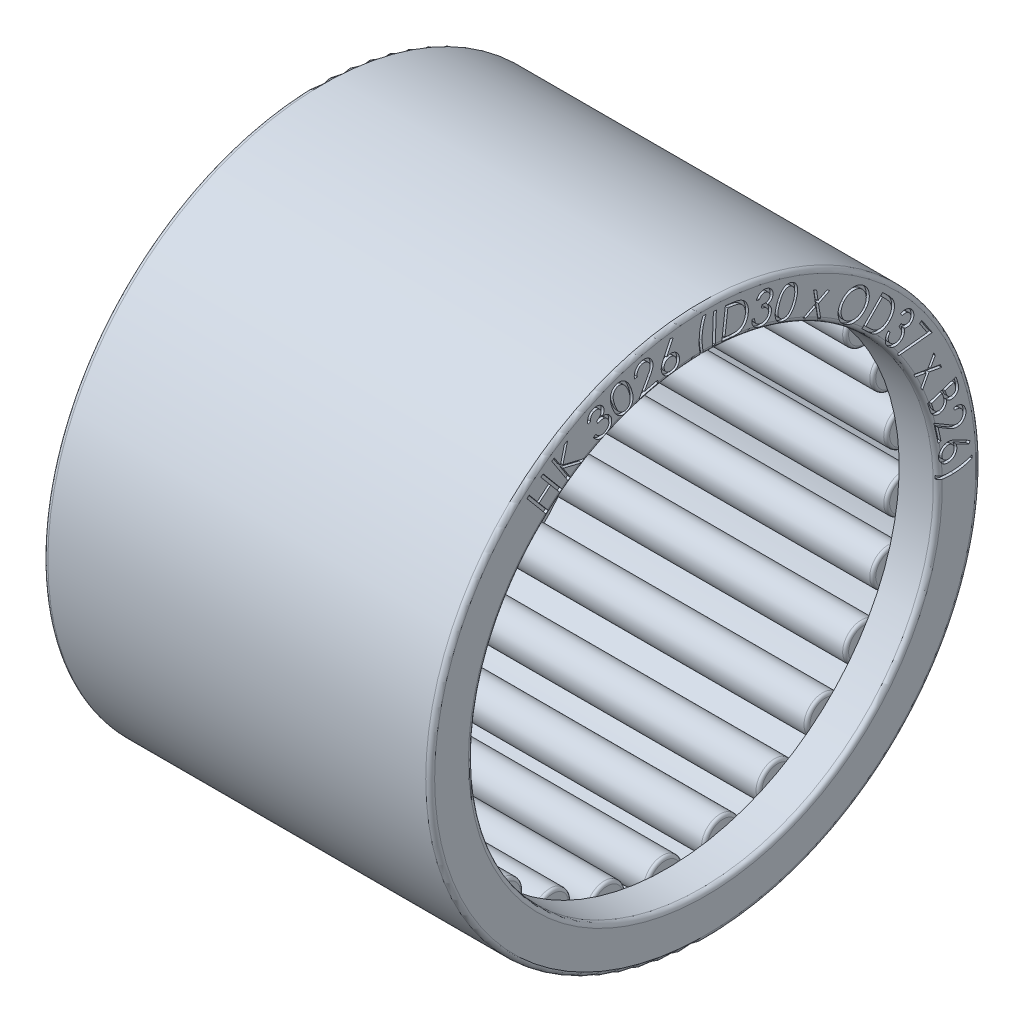
from build123d import *

# Parameters (mm, degrees)
FILLET1_R         = 0.3
EXTRUDE1_DEPTH    = 0.2
CIRPATTERN1_COUNT = 26


with BuildPart() as part:
    # Sketch1 → Revolve1 (revolve)
    with BuildSketch(Plane.XY):
        Polygon((0, 18.5), (0, 15.625), (2.6, 15.625), (2.6, 17.5), (23.4, 17.5), (23.4, 15.625), (26, 15.625), (26, 18.5), align=None)
    revolve(axis=Axis((0, 0, 0), (1, 0, 0)))

    # Fillet1
    fillet1_edges = [part.edges().sort_by_distance(p)[0] for p in [
        (0, -18.5, 0),
        (26, -15.625, 0),
        (26, -18.5, 0),
        (0, -15.625, 0),
    ]]
    fillet(fillet1_edges, radius=FILLET1_R)

    # Sketch2 → Extrude1 (cut)
    # profile 1 of 21: a face of its own
    with BuildSketch(Plane(origin=(26, 0, 0), x_dir=(0, 0, -1), z_dir=(1, 0, 0))):
        with BuildLine():
            Line((15.270640151, 0.564405054), (15.26222669, 0.783155054))
            add(Edge.make_bspline(
                [(15.26222669, 0.783155054), (15.285645564, 0.772929957), (15.333162884, 0.752183051), (15.406902763, 0.7246062), (15.483062058, 0.697920136), (15.562062196, 0.673544661), (15.643889694, 0.651193198), (15.728339913, 0.630453462), (15.8155074, 0.611028097), (15.935635207, 0.588231211), (16.089053904, 0.564956994), (16.275774587, 0.5475975), (16.465032464, 0.539440368), (16.59181872, 0.542454655), (16.655656177, 0.543972362)],
                knots=[0, 0, 0, 0, 0.645354642, 1.309436225, 1.987926196, 2.683590395, 3.397195893, 4.130253231, 4.879948319, 5.65267169, 7.218402684, 8.797341213, 10.38744673, 12, 12, 12, 12], degree=3))
            add(Edge.make_bspline(
                [(16.655656177, 0.543972362), (16.714589089, 0.547051255), (16.831588752, 0.553163789), (17.004952212, 0.571523927), (17.174913648, 0.596569158), (17.34010774, 0.629323393), (17.498564925, 0.668138486), (17.647897901, 0.712682884), (17.78735822, 0.761618794), (17.875029652, 0.800365366), (17.917675408, 0.819212746)],
                knots=[0, 0, 0, 0, 1.089768916, 2.163521036, 3.218364129, 4.26175738, 5.272750886, 6.23026948, 7.139155207, 8, 8, 8, 8], degree=3))
            Line((17.917675408, 0.819212746), (17.926088869, 0.610879413))
            add(Edge.make_bspline(
                [(17.926088869, 0.610879413), (17.905974595, 0.601814179), (17.864945325, 0.583322837), (17.801521678, 0.557412089), (17.735302749, 0.533049564), (17.666467862, 0.509786058), (17.595088621, 0.487305858), (17.520743031, 0.466563157), (17.443800278, 0.446926285), (17.337203144, 0.422309581), (17.200382793, 0.39549695), (17.03272763, 0.370814773), (16.861498895, 0.352827353), (16.745972033, 0.346994313), (16.687707459, 0.34405249)],
                knots=[0, 0, 0, 0, 0.623200467, 1.271209667, 1.934843109, 2.616032859, 3.323580035, 4.04853291, 4.796063214, 5.566580768, 7.138760372, 8.732905366, 10.352280358, 12, 12, 12, 12], degree=3))
            add(Edge.make_bspline(
                [(16.687707459, 0.34405249), (16.624941376, 0.34249212), (16.500051522, 0.339387349), (16.313388425, 0.345851109), (16.12861869, 0.360556172), (15.946465575, 0.383995702), (15.768637481, 0.41637795), (15.596366954, 0.456850322), (15.43029511, 0.505140511), (15.323442267, 0.544804703), (15.270640151, 0.564405054)],
                knots=[0, 0, 0, 0, 1.043444001, 2.076209977, 3.102850415, 4.123538581, 5.127601856, 6.105952864, 7.064042719, 8, 8, 8, 8], degree=3))
        make_face()
    # profile 2 of 21: a face of its own
    with BuildSketch(Plane(origin=(26, 0, 0), x_dir=(0, 0, -1), z_dir=(1, 0, 0))):
        with BuildLine():
            Line((17.794548794, 1.716877211), (17.706808409, 1.542999005))
            Line((17.706808409, 1.542999005), (16.841423794, 1.98610798))
            add(Edge.make_bspline(
                [(16.841423794, 1.98610798), (16.849103358, 1.969278826), (16.864100111, 1.936414641), (16.880432765, 1.88616504), (16.893605733, 1.837445787), (16.898107502, 1.804949421), (16.900318024, 1.788992595)],
                knots=[0, 0, 0, 0, 1.073517112, 2.096377909, 3.065256516, 4, 4, 4, 4], degree=3))
            add(Edge.make_bspline(
                [(16.900318024, 1.788992595), (16.901928867, 1.769775173), (16.905103754, 1.731898643), (16.90274578, 1.675519113), (16.895713634, 1.620735975), (16.882917159, 1.567446087), (16.86378102, 1.51603776), (16.839613313, 1.466148699), (16.8102392, 1.417649891), (16.775214503, 1.371823883), (16.736077253, 1.329032144), (16.693704328, 1.290471342), (16.648047329, 1.256899086), (16.59919432, 1.228433017), (16.547546396, 1.20419342), (16.492672944, 1.185521915), (16.435049006, 1.171161959), (16.395311877, 1.165880595), (16.37507764, 1.163191313)],
                knots=[0, 0, 0, 0, 1.015936381, 2.002357301, 2.968335335, 3.924718861, 4.884853584, 5.854826878, 6.843858046, 7.869097645, 8.890776574, 9.897766982, 10.885016901, 11.872869292, 12.874651753, 13.887851468, 14.924489113, 16, 16, 16, 16], degree=3))
            add(Edge.make_bspline(
                [(16.37507764, 1.163191313), (16.347174044, 1.16091138), (16.292387253, 1.156434889), (16.211189551, 1.163688001), (16.132889635, 1.179298775), (16.058424348, 1.206408409), (15.988304652, 1.242974235), (15.923823039, 1.288914193), (15.865524624, 1.344117217), (15.814355198, 1.407590832), (15.770630945, 1.477260408), (15.737023294, 1.552022837), (15.71207219, 1.630372493), (15.704314184, 1.684664425), (15.700398153, 1.712069518)],
                knots=[0, 0, 0, 0, 1.037473329, 2.037007476, 3.014064458, 3.99408466, 4.967462799, 5.941333094, 6.923194512, 7.938159281, 8.960169149, 9.967344469, 10.973970683, 12, 12, 12, 12], degree=3))
            add(Edge.make_bspline(
                [(15.700398153, 1.712069518), (15.698299936, 1.73877273), (15.694141202, 1.791699379), (15.701346713, 1.870757139), (15.717093968, 1.948025461), (15.743775499, 2.022455779), (15.779447156, 2.092910081), (15.824941991, 2.157141614), (15.878614261, 2.21507542), (15.940781731, 2.265235256), (16.008986427, 2.30744005), (16.08148616, 2.341078329), (16.157921801, 2.364873304), (16.210670916, 2.37249228), (16.237257127, 2.376332339)],
                knots=[0, 0, 0, 0, 1.011953326, 2.005724997, 2.991873836, 3.989236661, 4.98818573, 5.971014281, 6.957900883, 7.967340129, 8.984039265, 9.985707227, 10.984771328, 12, 12, 12, 12], degree=3))
            add(Edge.make_bspline(
                [(16.237257127, 2.376332339), (16.257676905, 2.378131649), (16.299287126, 2.381798177), (16.363279092, 2.37856327), (16.429533018, 2.370852808), (16.498907569, 2.355809931), (16.573297742, 2.333799786), (16.654333521, 2.302763362), (16.743371677, 2.263411095), (16.804444857, 2.232407534), (16.836616101, 2.216075928)],
                knots=[0, 0, 0, 0, 0.780372053, 1.590196253, 2.436128875, 3.32055047, 4.291653138, 5.390113455, 6.625201824, 8, 8, 8, 8], degree=3))
            Line((16.836616101, 2.216075928), (17.794548794, 1.716877211))
        make_face()
        with BuildLine():
            add(Edge.make_bspline(
                [(16.722032768, 1.817037467), (16.720230998, 1.831124257), (16.716692853, 1.858786574), (16.705693069, 1.89872664), (16.692402998, 1.936857958), (16.674922998, 1.973015391), (16.653530986, 2.006883168), (16.629207209, 2.039388781), (16.600237567, 2.068827856), (16.569093229, 2.096830672), (16.535039267, 2.12149496), (16.499635162, 2.142836458), (16.462598267, 2.159749143), (16.424726337, 2.173160847), (16.38540502, 2.181814988), (16.345070093, 2.187147862), (16.303435745, 2.188441731), (16.275439396, 2.186039526), (16.261295588, 2.184825928)],
                knots=[0, 0, 0, 0, 1.037887633, 2.038106425, 3.024094714, 3.989976151, 4.968820383, 5.951899, 6.954025334, 7.985452641, 9.013541685, 10.025765146, 11.005145771, 11.987884366, 12.959826797, 13.945233839, 14.961928377, 16, 16, 16, 16], degree=3))
            add(Edge.make_bspline(
                [(16.261295588, 2.184825928), (16.247208766, 2.183024193), (16.219546386, 2.179486113), (16.179606779, 2.168485848), (16.141473767, 2.155197558), (16.105322547, 2.137711021), (16.071431342, 2.116343656), (16.038936997, 2.091868366), (16.009098996, 2.063176472), (15.9811206, 2.03186661), (15.956432803, 1.997837217), (15.935096014, 1.962428609), (15.918239781, 1.925500802), (15.904824557, 1.887752871), (15.895594362, 1.848656559), (15.890452605, 1.80852159), (15.889086562, 1.767166733), (15.891483357, 1.73943518), (15.892705845, 1.725290672)],
                knots=[0, 0, 0, 0, 1.039152739, 2.040590721, 3.027780853, 3.994839625, 4.974876993, 5.959153908, 6.969584245, 8.002268782, 9.031610988, 10.045068271, 11.025642686, 12.000342414, 12.975680275, 13.962288452, 14.960663047, 16, 16, 16, 16], degree=3))
            add(Edge.make_bspline(
                [(15.892705845, 1.725290672), (15.894507616, 1.711203885), (15.898045766, 1.683541573), (15.909045522, 1.643601468), (15.922335692, 1.605470294), (15.93981533, 1.569312333), (15.961208709, 1.535446547), (15.985527313, 1.502933403), (16.01451683, 1.473523265), (16.045664953, 1.445336435), (16.080010547, 1.421105677), (16.115233334, 1.399242287), (16.152357837, 1.382756782), (16.190168689, 1.369198823), (16.229278799, 1.359995907), (16.269410026, 1.354846751), (16.310765891, 1.353482702), (16.338497305, 1.355879222), (16.352641742, 1.357101569)],
                knots=[0, 0, 0, 0, 1.039065973, 2.040420339, 3.027528044, 3.994506071, 4.974461609, 5.958656341, 6.961920414, 7.994518726, 9.031694774, 10.036674482, 11.026058027, 12.000676371, 12.975932795, 13.962458594, 14.960749828, 16, 16, 16, 16], degree=3))
            add(Edge.make_bspline(
                [(16.352641742, 1.357101569), (16.36670257, 1.359144065), (16.394389364, 1.363165888), (16.434797072, 1.373062391), (16.472920745, 1.387513161), (16.509619836, 1.404216127), (16.543340124, 1.426157787), (16.575817604, 1.450430639), (16.605635178, 1.479159755), (16.63361921, 1.510459348), (16.658305494, 1.544491496), (16.679642679, 1.579899383), (16.696498811, 1.616827376), (16.709914062, 1.654575257), (16.71914425, 1.693671582), (16.724286009, 1.733806548), (16.725652051, 1.775161406), (16.723255256, 1.802892959), (16.722032768, 1.817037467)],
                knots=[0, 0, 0, 0, 1.039289652, 2.046436934, 3.035651377, 4.019058249, 4.989516955, 5.972486876, 6.981575489, 8.012888752, 9.040864123, 10.052975664, 11.032248, 12.005653451, 12.979696187, 13.964994274, 14.962043154, 16, 16, 16, 16], degree=3))
        make_face(mode=Mode.SUBTRACT)
    # profile 3 of 21: a face of its own
    with BuildSketch(Plane(origin=(26, 0, 0), x_dir=(0, 0, -1), z_dir=(1, 0, 0))):
        with BuildLine():
            Line((16.743358851, 3.983880635), (16.702894108, 4.16937743))
            add(Edge.make_bspline(
                [(16.702894108, 4.16937743), (16.72648081, 4.173263687), (16.772922478, 4.180915638), (16.842264781, 4.185097251), (16.909584565, 4.183750993), (16.974859981, 4.175795012), (17.038045527, 4.161001205), (17.099578665, 4.141262802), (17.158892252, 4.11452144), (17.21533373, 4.081575638), (17.268812267, 4.044518758), (17.317197346, 4.002386611), (17.360696578, 3.956636078), (17.399053821, 3.906802409), (17.431404138, 3.852640488), (17.459378261, 3.794994667), (17.481899657, 3.733214077), (17.492427429, 3.690058862), (17.497765903, 3.668175507)],
                knots=[0, 0, 0, 0, 1.095360454, 2.156739184, 3.1795355, 4.178955081, 5.165177747, 6.150715958, 7.137318671, 8.141304057, 9.143495543, 10.115764097, 11.07725389, 12.033681168, 12.992379133, 13.964532007, 14.967845057, 16, 16, 16, 16], degree=3))
            add(Edge.make_bspline(
                [(17.497765903, 3.668175507), (17.502094736, 3.64633961), (17.510570102, 3.603587399), (17.515328151, 3.539529265), (17.51541028, 3.477550169), (17.508437697, 3.417521455), (17.495593003, 3.359511651), (17.476764468, 3.303378326), (17.451172771, 3.249608074), (17.420457602, 3.198088251), (17.385160704, 3.150171286), (17.346367501, 3.106485162), (17.304657917, 3.067401335), (17.259616525, 3.033262485), (17.211524069, 3.003848391), (17.160562376, 2.978786678), (17.106179058, 2.959156815), (17.068504766, 2.949767632), (17.049448595, 2.945018455)],
                knots=[0, 0, 0, 0, 1.123561824, 2.199806769, 3.238762655, 4.250486438, 5.245655066, 6.235550329, 7.234484875, 8.248006479, 9.261348445, 10.236186509, 11.195612538, 12.144161126, 13.085992494, 14.039422646, 15.008313236, 16, 16, 16, 16], degree=3))
            add(Edge.make_bspline(
                [(17.049448595, 2.945018455), (17.022294984, 2.940028279), (16.968304191, 2.930106078), (16.886012579, 2.927980615), (16.804281914, 2.936764781), (16.736058644, 2.952019689), (16.680004935, 2.970966827), (16.633230545, 2.988561469), (16.582657043, 3.010841949), (16.527577476, 3.036530085), (16.468369713, 3.066145132), (16.405145315, 3.100084682), (16.337251594, 3.13706698), (16.291223793, 3.164164427), (16.267397313, 3.178191532)],
                knots=[0, 0, 0, 0, 1.185345503, 2.35687786, 3.522672388, 4.71190337, 5.352689062, 6.064859408, 6.859308549, 7.727313018, 8.67715876, 9.704339865, 10.811642143, 12, 12, 12, 12], degree=3))
            Line((16.267397313, 3.178191532), (15.643599236, 3.546380635))
            Line((15.643599236, 3.546380635), (15.837910133, 2.65375243))
            Line((15.837910133, 2.65375243), (15.651211415, 2.612887045))
            Line((15.651211415, 2.612887045), (15.365153723, 3.926188327))
            Line((15.365153723, 3.926188327), (16.324288338, 3.361284481))
            add(Edge.make_bspline(
                [(16.324288338, 3.361284481), (16.347509556, 3.347636128), (16.392236974, 3.321347429), (16.456902001, 3.283916366), (16.517036567, 3.251219075), (16.571960113, 3.222160828), (16.622050392, 3.197304608), (16.667089776, 3.176305745), (16.707432775, 3.159870635), (16.753875687, 3.142572895), (16.809324227, 3.128306428), (16.875194864, 3.120866372), (16.940776462, 3.121024245), (16.983543465, 3.128681028), (17.004977441, 3.132518455)],
                knots=[0, 0, 0, 0, 1.316795653, 2.536338512, 3.652424721, 4.66285853, 5.573819426, 6.385930018, 7.091545212, 7.702878695, 8.808142645, 9.879528946, 10.937261865, 12, 12, 12, 12], degree=3))
            add(Edge.make_bspline(
                [(17.004977441, 3.132518455), (17.018303302, 3.13565365), (17.044612287, 3.141843402), (17.081743352, 3.156839252), (17.117267434, 3.173839294), (17.14994827, 3.195479708), (17.181269091, 3.219649545), (17.208978701, 3.248619163), (17.235544978, 3.280021901), (17.259078657, 3.314917258), (17.279856845, 3.351846787), (17.296831486, 3.390186981), (17.309832708, 3.429470428), (17.317984279, 3.469842343), (17.323171661, 3.510844957), (17.323124311, 3.552709609), (17.320337135, 3.595560209), (17.314728773, 3.624015607), (17.311868467, 3.638528071)],
                knots=[0, 0, 0, 0, 0.99733418, 1.969017225, 2.914604401, 3.865947184, 4.823110152, 5.794597766, 6.783903442, 7.821683545, 8.859875239, 9.871950543, 10.876446062, 11.872065298, 12.872773114, 13.886160854, 14.921926381, 16, 16, 16, 16], degree=3))
            add(Edge.make_bspline(
                [(17.311868467, 3.638528071), (17.308118181, 3.653560349), (17.300725729, 3.683191528), (17.285432023, 3.725569526), (17.267070645, 3.765383758), (17.244414089, 3.801849946), (17.218547944, 3.835688307), (17.189796008, 3.867203904), (17.156959921, 3.895340426), (17.120941225, 3.920471168), (17.082242828, 3.942479687), (17.040951019, 3.960751849), (16.997138495, 3.974688526), (16.950854584, 3.984695696), (16.902310086, 3.990632494), (16.851402252, 3.992530516), (16.7980841, 3.990600785), (16.761897319, 3.986157121), (16.743358851, 3.983880635)],
                knots=[0, 0, 0, 0, 1.003653473, 1.978371878, 2.915466285, 3.840367906, 4.75447256, 5.673319047, 6.600001194, 7.550945721, 8.516162741, 9.481185674, 10.472142245, 11.490837836, 12.546236656, 13.637756809, 14.789824136, 16, 16, 16, 16], degree=3))
        make_face()
    # profile 4 of 21: a face of its own
    with BuildSketch(Plane(origin=(26, 0, 0), x_dir=(0, 0, -1), z_dir=(1, 0, 0))):
        with BuildLine():
            Line((16.842582006, 5.889269666), (16.961572391, 5.515471589))
            add(Edge.make_bspline(
                [(16.961572391, 5.515471589), (16.967345792, 5.497090043), (16.978497275, 5.461585586), (16.992056654, 5.409100756), (17.003242614, 5.359528032), (17.012428369, 5.312708675), (17.01785377, 5.268376661), (17.021279678, 5.226942568), (17.021783143, 5.188107327), (17.018623203, 5.140644227), (17.008503511, 5.084377256), (16.987294004, 5.020541947), (16.956319959, 4.960907686), (16.916675776, 4.906186603), (16.869482205, 4.857470221), (16.816121072, 4.815710555), (16.756648067, 4.781747771), (16.713453253, 4.76643097), (16.691540339, 4.758660692)],
                knots=[0, 0, 0, 0, 1.013691761, 1.957973345, 2.851302329, 3.687909611, 4.467152189, 5.200154248, 5.874815147, 6.508679336, 7.701030107, 8.87215212, 10.035064836, 11.2228718, 12.415615966, 13.592207002, 14.77851631, 16, 16, 16, 16], degree=3))
            add(Edge.make_bspline(
                [(16.691540339, 4.758660692), (16.670704091, 4.752718256), (16.629672105, 4.741016056), (16.56630781, 4.733994351), (16.503391719, 4.735663178), (16.441057395, 4.745612117), (16.380257732, 4.764464947), (16.322015236, 4.792660836), (16.266072351, 4.829294028), (16.232422708, 4.859676844), (16.21517816, 4.87524723)],
                knots=[0, 0, 0, 0, 1.005532343, 1.980154316, 2.948670719, 3.923095061, 4.904609083, 5.895633157, 6.921567925, 8, 8, 8, 8], degree=3))
            add(Edge.make_bspline(
                [(16.21517816, 4.87524723), (16.214187538, 4.849053061), (16.212307243, 4.799334051), (16.204278352, 4.728439182), (16.190323166, 4.665681329), (16.171932053, 4.609713381), (16.147385022, 4.560001692), (16.119174387, 4.513595356), (16.08506731, 4.471000511), (16.046635163, 4.431716058), (16.003880907, 4.396288947), (15.956591814, 4.366331993), (15.905932372, 4.340672747), (15.869986483, 4.327982826), (15.85179675, 4.321561333)],
                knots=[0, 0, 0, 0, 1.321037571, 2.507454265, 3.590199714, 4.556594654, 5.468794609, 6.378532548, 7.288917722, 8.212348594, 9.144885465, 10.080357251, 11.028601313, 12, 12, 12, 12], degree=3))
            add(Edge.make_bspline(
                [(15.85179675, 4.321561333), (15.832928383, 4.316092025), (15.795848835, 4.305343906), (15.739261414, 4.296189263), (15.683286287, 4.293017875), (15.627805863, 4.295267227), (15.572872014, 4.303829073), (15.518481491, 4.318344359), (15.46468231, 4.339092528), (15.4116258, 4.364826467), (15.360842852, 4.396304097), (15.313670152, 4.43351801), (15.270190852, 4.475833191), (15.230537729, 4.523261093), (15.194496283, 4.575737391), (15.163198939, 4.633720505), (15.134782285, 4.696434152), (15.119594688, 4.740757643), (15.111812775, 4.763468384)],
                knots=[0, 0, 0, 0, 0.97571361, 1.917443115, 2.841604845, 3.758467455, 4.671887772, 5.599285671, 6.550974443, 7.533572511, 8.526341196, 9.514282974, 10.514105126, 11.536498881, 12.582241275, 13.672455648, 14.807398657, 16, 16, 16, 16], degree=3))
            Line((15.111812775, 4.763468384), (14.94554675, 5.284301717))
            Line((14.94554675, 5.284301717), (16.842582006, 5.889269666))
        make_face()
        with BuildLine():
            Line((16.715979442, 5.644077358), (16.108607647, 5.450567743))
            Line((16.108607647, 5.450567743), (16.143062775, 5.342394666))
            add(Edge.make_bspline(
                [(16.143062775, 5.342394666), (16.148175158, 5.326603871), (16.158102468, 5.295941043), (16.174030132, 5.252120991), (16.190234422, 5.211845429), (16.205908105, 5.175002205), (16.222456645, 5.142082159), (16.238949574, 5.112702592), (16.255078919, 5.08666308), (16.27691296, 5.057331705), (16.306541901, 5.026214778), (16.34571819, 4.994951733), (16.388686088, 4.970067178), (16.435150901, 4.952596865), (16.483386482, 4.942276928), (16.53223947, 4.938884824), (16.581115342, 4.943155755), (16.612714161, 4.951813358), (16.628639698, 4.956176717)],
                knots=[0, 0, 0, 0, 1.131451511, 2.197071292, 3.177624093, 4.090953213, 4.925615612, 5.687871871, 6.387534554, 7.012085617, 8.177743781, 9.30526924, 10.418702621, 11.548211157, 12.674964477, 13.769894078, 14.876045522, 16, 16, 16, 16], degree=3))
            add(Edge.make_bspline(
                [(16.628639698, 4.956176717), (16.639134591, 4.959853445), (16.659557418, 4.967008274), (16.688298055, 4.980813552), (16.714484393, 4.996748614), (16.737793016, 5.015294067), (16.758507096, 5.035979392), (16.776667778, 5.058885046), (16.791965979, 5.084350128), (16.804398521, 5.112211317), (16.814064036, 5.142411469), (16.820524162, 5.175191734), (16.823192297, 5.210540032), (16.822170891, 5.248473905), (16.818043508, 5.28902505), (16.810851255, 5.332285488), (16.79989608, 5.377990892), (16.790527204, 5.408947095), (16.78569098, 5.424926717)],
                knots=[0, 0, 0, 0, 0.949014011, 1.846760022, 2.717143624, 3.561358528, 4.38388126, 5.21207663, 6.05111486, 6.913768903, 7.811804602, 8.75338928, 9.760124063, 10.832356319, 11.989806825, 13.238443546, 14.574481858, 16, 16, 16, 16], degree=3))
            Line((16.78569098, 5.424926717), (16.715979442, 5.644077358))
        make_face(mode=Mode.SUBTRACT)
        with BuildLine():
            Line((15.917902519, 5.389670307), (15.190739057, 5.157699153))
            Line((15.190739057, 5.157699153), (15.265258288, 4.923324153))
            add(Edge.make_bspline(
                [(15.265258288, 4.923324153), (15.270766601, 4.906595443), (15.281388994, 4.874335301), (15.298400649, 4.828181834), (15.31479888, 4.785714409), (15.332471981, 4.747479325), (15.349154926, 4.712629823), (15.36708246, 4.682082582), (15.384474666, 4.655140348), (15.407854506, 4.624795593), (15.439667692, 4.59244057), (15.482076268, 4.560143766), (15.528641766, 4.534057775), (15.578991329, 4.515563372), (15.631006895, 4.503822324), (15.683401559, 4.500152004), (15.735254939, 4.504317187), (15.768566664, 4.513343769), (15.785290339, 4.517875435)],
                knots=[0, 0, 0, 0, 1.132181537, 2.183332505, 3.162259807, 4.057569794, 4.890786766, 5.644771018, 6.332972068, 6.951206437, 8.104769727, 9.238122622, 10.368088282, 11.522705478, 12.674670105, 13.784925454, 14.887953434, 16, 16, 16, 16], degree=3))
            add(Edge.make_bspline(
                [(15.785290339, 4.517875435), (15.805375643, 4.525464176), (15.844939953, 4.540412584), (15.898254773, 4.574622455), (15.943371999, 4.618628325), (15.981049863, 4.67049351), (16.010485443, 4.729586581), (16.029531084, 4.794803859), (16.039104494, 4.86523541), (16.037118777, 4.913554447), (16.036091621, 4.938548512)],
                knots=[0, 0, 0, 0, 0.969899116, 1.910520795, 2.842420994, 3.807202471, 4.799261439, 5.814742408, 6.869628349, 8, 8, 8, 8], degree=3))
            add(Edge.make_bspline(
                [(16.036091621, 4.938548512), (16.035283561, 4.948046089), (16.033546336, 4.968464643), (16.027937639, 5.000881894), (16.020817125, 5.037534508), (16.010967765, 5.078335845), (15.999405293, 5.123493659), (15.985752602, 5.172946518), (15.969676325, 5.226452625), (15.95801091, 5.263482215), (15.951957006, 5.282699153)],
                knots=[0, 0, 0, 0, 0.644254057, 1.385062296, 2.222733736, 3.16896968, 4.222452199, 5.374822754, 6.637633548, 8, 8, 8, 8], degree=3))
            Line((15.951957006, 5.282699153), (15.917902519, 5.389670307))
        make_face(mode=Mode.SUBTRACT)
    # profile 5 of 21: a face of its own
    with BuildSketch(Plane(origin=(26, 0, 0), x_dir=(0, 0, -1), z_dir=(1, 0, 0))):
        Polygon((15.350534174, 8.030201938), (15.448290584, 7.826275656), (15.12657584, 7.242141041), (15.783627122, 7.126756426), (15.881383533, 6.922429502), (15.037232892, 7.073471169), (14.58731302, 6.232525656), (14.488755327, 6.438855785), (14.849732892, 7.109528861), (14.103739302, 7.2417404), (14.006784174, 7.444464759), (14.939877122, 7.276195528), align=None)
    # profile 6 of 21: a face of its own
    with BuildSketch(Plane(origin=(26, 0, 0), x_dir=(0, 0, -1), z_dir=(1, 0, 0))):
        Polygon((14.549821125, 10.322158422), (15.245734586, 9.270475729), (12.959676894, 9.033296242), (12.939244202, 9.215587909), (14.918811509, 9.424321883), (14.393170484, 10.218793037), align=None)
    # profile 7 of 21: a face of its own
    with BuildSketch(Plane(origin=(26, 0, 0), x_dir=(0, 0, -1), z_dir=(1, 0, 0))):
        with BuildLine():
            Line((13.233937711, 11.264873445), (13.105732583, 11.422325368))
            add(Edge.make_bspline(
                [(13.105732583, 11.422325368), (13.124317921, 11.431127464), (13.160863974, 11.448435832), (13.216455911, 11.469518844), (13.27128365, 11.48626105), (13.32543062, 11.497891718), (13.378905613, 11.504847375), (13.431594836, 11.506747184), (13.483496684, 11.504517096), (13.534447076, 11.497221439), (13.583822975, 11.485542102), (13.631580781, 11.470463575), (13.676951017, 11.450614434), (13.720414887, 11.426922748), (13.761652242, 11.399213109), (13.800906481, 11.367712312), (13.837878893, 11.331985283), (13.860355775, 11.305535118), (13.871758224, 11.292117035)],
                knots=[0, 0, 0, 0, 1.16661686, 2.294025698, 3.37053807, 4.416992986, 5.433151396, 6.426674868, 7.405375103, 8.377480327, 9.342588485, 10.282094152, 11.215527942, 12.148192271, 13.08775907, 14.031077867, 15.001172163, 16, 16, 16, 16], degree=3))
            add(Edge.make_bspline(
                [(13.871758224, 11.292117035), (13.887259589, 11.271783321), (13.918035357, 11.231413607), (13.954318697, 11.164787071), (13.982271369, 11.094839014), (14.001374801, 11.022311362), (14.011490332, 10.948976936), (14.012041315, 10.87662246), (14.002820426, 10.806210459), (13.983885586, 10.738820819), (13.957128149, 10.675572308), (13.923371816, 10.617709652), (13.882379187, 10.565991454), (13.849652272, 10.537250054), (13.833296686, 10.522886266)],
                knots=[0, 0, 0, 0, 1.075916506, 2.136080139, 3.183990606, 4.242989109, 5.287738085, 6.294859513, 7.28234935, 8.269278045, 9.234854788, 10.167954065, 11.084417636, 12, 12, 12, 12], degree=3))
            add(Edge.make_bspline(
                [(13.833296686, 10.522886266), (13.816540121, 10.510213529), (13.783653179, 10.485341631), (13.729124616, 10.457380447), (13.672685097, 10.436739803), (13.613418244, 10.425796014), (13.55196885, 10.422433771), (13.488110749, 10.428230407), (13.421633581, 10.441075404), (13.377870112, 10.456466346), (13.355331942, 10.464392676)],
                knots=[0, 0, 0, 0, 0.994589816, 1.952012167, 2.893467208, 3.834922249, 4.798857184, 5.802838461, 6.868462631, 8, 8, 8, 8], degree=3))
            add(Edge.make_bspline(
                [(13.355331942, 10.464392676), (13.361970511, 10.439949995), (13.375068731, 10.391723389), (13.38359239, 10.318019615), (13.383309135, 10.24495164), (13.375346777, 10.19736734), (13.371357583, 10.173527291)],
                knots=[0, 0, 0, 0, 1.031589682, 2.035376921, 3.015710846, 4, 4, 4, 4], degree=3))
            add(Edge.make_bspline(
                [(13.371357583, 10.173527291), (13.367575827, 10.157177886), (13.360091124, 10.124819784), (13.345079567, 10.077830724), (13.325434273, 10.033580821), (13.303183012, 9.991519993), (13.277431439, 9.951737463), (13.247382777, 9.915065789), (13.214846041, 9.879772974), (13.190235589, 9.859042209), (13.177847968, 9.84860742)],
                knots=[0, 0, 0, 0, 1.043149447, 2.064560404, 3.061065566, 4.049129296, 5.02097715, 6.001300581, 6.993958687, 8, 8, 8, 8], degree=3))
            add(Edge.make_bspline(
                [(13.177847968, 9.84860742), (13.155459418, 9.831753778), (13.110795101, 9.798131396), (13.035568135, 9.760030115), (12.955502523, 9.730634395), (12.870842775, 9.712325143), (12.784303541, 9.703896944), (12.698137819, 9.70806613), (12.613552551, 9.723744294), (12.531368323, 9.751578049), (12.452783038, 9.790562346), (12.379005453, 9.839960465), (12.310081669, 9.899088456), (12.269973441, 9.945288782), (12.249562711, 9.968799727)],
                knots=[0, 0, 0, 0, 0.965708184, 1.926551586, 2.897811565, 3.903366488, 4.907980468, 5.890996061, 6.871121205, 7.868271595, 8.876433296, 9.890354525, 10.926419734, 12, 12, 12, 12], degree=3))
            add(Edge.make_bspline(
                [(12.249562711, 9.968799727), (12.23660792, 9.985432153), (12.211173455, 10.018087008), (12.178258381, 10.069519626), (12.150825492, 10.121828896), (12.12878975, 10.174989572), (12.111193033, 10.228858159), (12.099591339, 10.283800168), (12.093753208, 10.339640934), (12.092362193, 10.396086909), (12.096710149, 10.453036104), (12.107300233, 10.509774282), (12.123610013, 10.566295285), (12.145150894, 10.622869199), (12.173077402, 10.679028218), (12.206622596, 10.734874741), (12.245498139, 10.790771208), (12.274947467, 10.826636347), (12.290027455, 10.84500165)],
                knots=[0, 0, 0, 0, 1.048559376, 2.05866273, 3.033531427, 3.983743778, 4.918873923, 5.849389035, 6.771778262, 7.708912976, 8.655307328, 9.608025615, 10.575529159, 11.578812228, 12.615939823, 13.69170664, 14.818002394, 16, 16, 16, 16], degree=3))
            Line((12.290027455, 10.84500165), (12.41302425, 10.693559343))
            add(Edge.make_bspline(
                [(12.41302425, 10.693559343), (12.403700664, 10.68027921), (12.385583665, 10.654474101), (12.3609541, 10.615598948), (12.340153988, 10.57756317), (12.322646878, 10.540587003), (12.309122533, 10.504462757), (12.298484773, 10.469603745), (12.291462997, 10.435653781), (12.289424623, 10.413271056), (12.288424891, 10.402293317)],
                knots=[0, 0, 0, 0, 1.21321971, 2.35745129, 3.438915273, 4.452999612, 5.413711667, 6.320439395, 7.176249613, 8, 8, 8, 8], degree=3))
            add(Edge.make_bspline(
                [(12.288424891, 10.402293317), (12.288094048, 10.388658291), (12.287433669, 10.361442077), (12.292377721, 10.320830828), (12.300108994, 10.280646202), (12.312514993, 10.241038779), (12.32818544, 10.201743048), (12.349332412, 10.163613737), (12.372975384, 10.125322693), (12.391818003, 10.10124397), (12.40140566, 10.088992035)],
                knots=[0, 0, 0, 0, 0.959434797, 1.915081182, 2.874331526, 3.83836619, 4.834005062, 5.848221051, 6.905113968, 8, 8, 8, 8], degree=3))
            add(Edge.make_bspline(
                [(12.40140566, 10.088992035), (12.412800325, 10.075563923), (12.435139608, 10.049238058), (12.471719824, 10.01409898), (12.509493032, 9.983082087), (12.549299768, 9.957715595), (12.590135354, 9.93597078), (12.63259951, 9.91919693), (12.67663952, 9.907010205), (12.721688355, 9.899964628), (12.766615708, 9.897398965), (12.810477347, 9.897852461), (12.852942148, 9.903092771), (12.893780816, 9.912886638), (12.933318617, 9.926040592), (12.971267335, 9.943362354), (13.007571753, 9.965169969), (13.030169472, 9.982464577), (13.041630019, 9.991235625)],
                knots=[0, 0, 0, 0, 1.168095995, 2.290056695, 3.361411835, 4.406226246, 5.417147376, 6.427679914, 7.429664505, 8.443805199, 9.447239076, 10.413463961, 11.351179855, 12.279889157, 13.196380589, 14.112529118, 15.042759649, 16, 16, 16, 16], degree=3))
            add(Edge.make_bspline(
                [(13.041630019, 9.991235625), (13.056084339, 10.003897112), (13.084794018, 10.029045805), (13.120211825, 10.074360082), (13.14887745, 10.124635483), (13.170723897, 10.179228648), (13.185215095, 10.236631009), (13.191161727, 10.2953198), (13.189301215, 10.354411754), (13.180183823, 10.403867587), (13.167837739, 10.444327311), (13.1552784, 10.477199415), (13.139632719, 10.512369231), (13.120739145, 10.549724492), (13.098239288, 10.589016528), (13.071893699, 10.630083055), (13.043197748, 10.674050793), (13.022113277, 10.70352026), (13.011181301, 10.718799727)],
                knots=[0, 0, 0, 0, 1.127028709, 2.238544081, 3.359766714, 4.518182226, 5.682905766, 6.826772311, 7.97308546, 9.145869466, 9.768941755, 10.456829904, 11.212128371, 12.029784713, 12.915472397, 13.871179972, 14.896239384, 16, 16, 16, 16], degree=3))
            Line((13.011181301, 10.718799727), (13.153008224, 10.833783702))
            add(Edge.make_bspline(
                [(13.153008224, 10.833783702), (13.167475843, 10.816751305), (13.195845842, 10.783351953), (13.243800088, 10.739811587), (13.293414649, 10.701058234), (13.345878126, 10.669982306), (13.398297563, 10.645462293), (13.449234746, 10.628568074), (13.498159404, 10.620306419), (13.544710903, 10.619696385), (13.588821437, 10.626802739), (13.630334346, 10.639522265), (13.669230713, 10.658563746), (13.692248078, 10.67568509), (13.703889635, 10.684344599)],
                knots=[0, 0, 0, 0, 1.264838231, 2.480260217, 3.662155418, 4.826089569, 5.926308216, 6.936042533, 7.856504852, 8.726645417, 9.56132626, 10.377384249, 11.179325154, 12, 12, 12, 12], degree=3))
            add(Edge.make_bspline(
                [(13.703889635, 10.684344599), (13.711888558, 10.691425972), (13.727745112, 10.705463632), (13.749118124, 10.728502832), (13.766809258, 10.753942596), (13.782356787, 10.780686346), (13.793997735, 10.809851512), (13.804160242, 10.840334274), (13.809596825, 10.873027437), (13.813488241, 10.906859373), (13.813767504, 10.941346537), (13.811085236, 10.975719563), (13.804613155, 11.009570322), (13.794425573, 11.042898618), (13.781236093, 11.075784337), (13.764617872, 11.108104163), (13.744643144, 11.139759496), (13.729038804, 11.15976543), (13.721117199, 11.169921522)],
                knots=[0, 0, 0, 0, 0.948052398, 1.87935819, 2.78053101, 3.693553214, 4.618121023, 5.562832976, 6.539285411, 7.552459325, 8.583776156, 9.594728803, 10.608318662, 11.635813765, 12.683552687, 13.749109767, 14.857326557, 16, 16, 16, 16], degree=3))
            add(Edge.make_bspline(
                [(13.721117199, 11.169921522), (13.707431777, 11.185485479), (13.680653862, 11.215939076), (13.633134055, 11.252881552), (13.580928466, 11.280100654), (13.534188599, 11.295134011), (13.494704513, 11.302753285), (13.46289537, 11.30542328), (13.429255961, 11.305408336), (13.39368409, 11.302319747), (13.356306798, 11.297311539), (13.317027513, 11.289001708), (13.275994698, 11.278253139), (13.248189765, 11.269407487), (13.233937711, 11.264873445)],
                knots=[0, 0, 0, 0, 1.394742403, 2.729056818, 4.02963237, 5.344861449, 6.022832672, 6.73678378, 7.49295899, 8.287644854, 9.141894894, 10.033465038, 10.992007543, 12, 12, 12, 12], degree=3))
        make_face()
    # profile 8 of 21: a face of its own
    with BuildSketch(Plane(origin=(26, 0, 0), x_dir=(0, 0, -1), z_dir=(1, 0, 0))):
        with BuildLine():
            Line((10.524405717, 11.849199304), (11.913428153, 13.267468535))
            Line((11.913428153, 13.267468535), (12.207498665, 12.979407637))
            add(Edge.make_bspline(
                [(12.207498665, 12.979407637), (12.232996659, 12.95415611), (12.282119945, 12.905507653), (12.351146866, 12.833199367), (12.413395612, 12.764889156), (12.468276868, 12.700043205), (12.516261226, 12.639059571), (12.557199444, 12.581738479), (12.591740779, 12.528397674), (12.610250261, 12.492900259), (12.618956999, 12.476202509)],
                knots=[0, 0, 0, 0, 1.319631142, 2.542341966, 3.675809276, 4.717773809, 5.665830964, 6.528477051, 7.307805344, 8, 8, 8, 8], degree=3))
            add(Edge.make_bspline(
                [(12.618956999, 12.476202509), (12.629600684, 12.453387379), (12.65062403, 12.408323063), (12.675595615, 12.338656881), (12.693811533, 12.268321468), (12.707093701, 12.197540354), (12.7131217, 12.126042219), (12.714272779, 12.054087583), (12.708345902, 11.981601277), (12.696881759, 11.908958595), (12.679113137, 11.836796866), (12.655812189, 11.765680224), (12.62690869, 11.69589177), (12.592370395, 11.627501558), (12.551630863, 11.560756774), (12.505001465, 11.49568344), (12.453277733, 11.431419714), (12.414923654, 11.391006063), (12.395399306, 11.370433278)],
                knots=[0, 0, 0, 0, 0.999586598, 1.974377718, 2.934159968, 3.883019082, 4.830988223, 5.780514269, 6.738168868, 7.715726911, 8.698609392, 9.686588298, 10.685428721, 11.695974814, 12.726658695, 13.7878469, 14.873891701, 16, 16, 16, 16], degree=3))
            add(Edge.make_bspline(
                [(12.395399306, 11.370433278), (12.37797564, 11.353252087), (12.343621336, 11.319375871), (12.289180135, 11.272992474), (12.234122875, 11.230288944), (12.177306829, 11.192494307), (12.119133599, 11.159046947), (12.059361222, 11.130474883), (11.998745253, 11.105124091), (11.936829142, 11.085447468), (11.874707094, 11.069846685), (11.813189146, 11.058128371), (11.752549353, 11.050850966), (11.692833402, 11.047991088), (11.634030798, 11.049524174), (11.576077992, 11.055685958), (11.518992534, 11.065615438), (11.462387149, 11.080117013), (11.40545888, 11.099993161), (11.347944255, 11.126348673), (11.28880531, 11.158206829), (11.228196156, 11.195898415), (11.166759285, 11.240268153), (11.10355861, 11.289984711), (11.039630569, 11.34629952), (10.997294083, 11.386581811), (10.975527512, 11.407292253)],
                knots=[0, 0, 0, 0, 1.088545127, 2.146288226, 3.180379076, 4.18742736, 5.180296007, 6.163711696, 7.133749416, 8.101600311, 9.051422287, 9.982676852, 10.886371334, 11.766867965, 12.640762086, 13.501135058, 14.35797077, 15.217008699, 16.098467402, 17.037350995, 18.029080787, 19.08608911, 20.210744063, 21.399647083, 22.663073569, 24, 24, 24, 24], degree=3))
            Line((10.975527512, 11.407292253), (10.524405717, 11.849199304))
        make_face()
        with BuildLine():
            Line((10.79123264, 11.850000586), (10.955094819, 11.689343535))
            add(Edge.make_bspline(
                [(10.955094819, 11.689343535), (10.978785235, 11.666422096), (11.024344057, 11.622342086), (11.091112237, 11.560343866), (11.153321913, 11.504865758), (11.210854367, 11.455886604), (11.264075166, 11.413644565), (11.312888341, 11.378394383), (11.356945857, 11.34937751), (11.385678491, 11.33392875), (11.399005076, 11.326763407)],
                knots=[0, 0, 0, 0, 1.376061555, 2.646291478, 3.803262514, 4.855435264, 5.800120093, 6.638736158, 7.368627429, 8, 8, 8, 8], degree=3))
            add(Edge.make_bspline(
                [(11.399005076, 11.326763407), (11.416513108, 11.318599772), (11.451256962, 11.30239943), (11.504908698, 11.283348934), (11.558866005, 11.268731228), (11.613295547, 11.259006778), (11.66813338, 11.254374462), (11.723478717, 11.253802425), (11.779068044, 11.258400597), (11.834965503, 11.267144921), (11.89048433, 11.280710378), (11.945166921, 11.299223018), (11.998729462, 11.322639891), (12.051215704, 11.35088942), (12.102889492, 11.383220791), (12.153367384, 11.420456275), (12.202582279, 11.462566048), (12.233984332, 11.49337477), (12.249966614, 11.509055073)],
                knots=[0, 0, 0, 0, 0.990885443, 1.966364799, 2.917267955, 3.856967112, 4.799461067, 5.738385194, 6.693969111, 7.658432587, 8.639122092, 9.623039012, 10.617425828, 11.635339529, 12.679244759, 13.742916811, 14.851242557, 16, 16, 16, 16], degree=3))
            add(Edge.make_bspline(
                [(12.249966614, 11.509055073), (12.266228381, 11.526205032), (12.298108727, 11.559826632), (12.341212838, 11.61312868), (12.379248962, 11.667473226), (12.412443218, 11.723128434), (12.440397972, 11.780005008), (12.463823536, 11.837949926), (12.482399101, 11.896982695), (12.495611187, 11.957056879), (12.503453182, 12.017518911), (12.506988162, 12.07780796), (12.504432187, 12.137618816), (12.496757444, 12.19699346), (12.483921066, 12.255844204), (12.465891918, 12.314230142), (12.441955139, 12.371802973), (12.422771008, 12.409154824), (12.413027512, 12.428125586)],
                knots=[0, 0, 0, 0, 1.127350826, 2.210112498, 3.267219681, 4.290105776, 5.29892212, 6.288147932, 7.269647311, 8.248329498, 9.218929462, 10.176112434, 11.126334293, 12.07083426, 13.029479633, 13.996915943, 14.98264661, 16, 16, 16, 16], degree=3))
            add(Edge.make_bspline(
                [(12.413027512, 12.428125586), (12.404409399, 12.443203704), (12.386009281, 12.47539627), (12.352411966, 12.524069905), (12.311988307, 12.576506787), (12.265538253, 12.633328245), (12.212535883, 12.694409681), (12.152445659, 12.758986794), (12.085708946, 12.827563739), (12.038764625, 12.87424158), (12.014389691, 12.89847815)],
                knots=[0, 0, 0, 0, 0.673782642, 1.438561023, 2.292740917, 3.243072846, 4.286480583, 5.430773076, 6.665978429, 8, 8, 8, 8], degree=3))
            Line((12.014389691, 12.89847815), (11.914229435, 12.996635202))
            Line((11.914229435, 12.996635202), (10.79123264, 11.850000586))
        make_face(mode=Mode.SUBTRACT)
    # profile 9 of 21: a face of its own
    with BuildSketch(Plane(origin=(26, 0, 0), x_dir=(0, 0, -1), z_dir=(1, 0, 0))):
        with BuildLine():
            add(Edge.make_bspline(
                [(10.584388917, 14.356537109), (10.613314006, 14.33371904), (10.670136514, 14.288893597), (10.746001924, 14.213096903), (10.813260368, 14.133452596), (10.87121391, 14.04878247), (10.918728823, 13.95888353), (10.958106376, 13.864770582), (10.987240734, 13.765567774), (11.006992892, 13.66292278), (11.017552353, 13.559129108), (11.017716967, 13.45628488), (11.007064211, 13.355796722), (10.987131978, 13.257309068), (10.956502767, 13.161129559), (10.915190404, 13.067495404), (10.864262496, 12.975840931), (10.823210407, 12.918263865), (10.802337635, 12.888989032)],
                knots=[0, 0, 0, 0, 1.067224931, 2.096532818, 3.102273514, 4.085856639, 5.064406036, 6.045059144, 7.038467276, 8.055868307, 9.071300809, 10.058503863, 11.031570029, 11.995816822, 12.966731967, 13.9514116, 14.958403292, 16, 16, 16, 16], degree=3))
            add(Edge.make_bspline(
                [(10.802337635, 12.888989032), (10.780158615, 12.861024511), (10.73654736, 12.806037055), (10.662860101, 12.732299008), (10.58431829, 12.667665935), (10.500555983, 12.611848318), (10.411999623, 12.564725969), (10.317832614, 12.527431388), (10.218800253, 12.498949162), (10.115913121, 12.479564359), (10.011719431, 12.469570073), (9.908760842, 12.469216771), (9.808283463, 12.479996174), (9.710025452, 12.499778174), (9.614224959, 12.530584424), (9.520913635, 12.571385017), (9.429722615, 12.621834277), (9.372602841, 12.662708646), (9.34360366, 12.683460186)],
                knots=[0, 0, 0, 0, 1.043502332, 2.051869145, 3.042859551, 4.014845113, 4.991819688, 5.971976395, 6.972318578, 8.002171493, 9.030444668, 10.030626617, 11.008748888, 11.98185666, 12.957971531, 13.94655613, 14.957485525, 16, 16, 16, 16], degree=3))
            add(Edge.make_bspline(
                [(9.34360366, 12.683460186), (9.315384455, 12.705921437), (9.259810734, 12.750155685), (9.185183512, 12.824364076), (9.119278708, 12.903165194), (9.062955277, 12.987286625), (9.015911556, 13.076384569), (8.977526656, 13.170241873), (8.948745996, 13.269231413), (8.9294039, 13.371883989), (8.919291429, 13.475688055), (8.919323406, 13.578316708), (8.928724775, 13.678480814), (8.948540155, 13.776084542), (8.978256958, 13.871055948), (9.018384411, 13.963281542), (9.068060936, 14.053157401), (9.108132918, 14.109571633), (9.12845943, 14.13818775)],
                knots=[0, 0, 0, 0, 1.056497239, 2.08062142, 3.078473373, 4.063155866, 5.041977961, 6.026917168, 7.030243556, 8.058198123, 9.084519244, 10.082678252, 11.061868138, 12.028363644, 12.996498575, 13.973063944, 14.971836778, 16, 16, 16, 16], degree=3))
            add(Edge.make_bspline(
                [(9.12845943, 14.13818775), (9.143057275, 14.156805413), (9.172010091, 14.193730985), (9.219161209, 14.245484856), (9.268730963, 14.293777981), (9.321604487, 14.337709979), (9.376330979, 14.378949093), (9.434462092, 14.415681774), (9.494750671, 14.44947923), (9.557639596, 14.478946391), (9.6219669, 14.504563637), (9.687101051, 14.525892877), (9.752908566, 14.542167148), (9.819023031, 14.555095099), (9.88593282, 14.561767035), (9.953210237, 14.565383704), (10.020944883, 14.563528473), (10.08892989, 14.557609222), (10.156223156, 14.547187975), (10.222387716, 14.532810492), (10.286823669, 14.51383376), (10.34988947, 14.491212007), (10.410971907, 14.463543873), (10.470755981, 14.432539066), (10.528675977, 14.396622627), (10.565709484, 14.36997698), (10.584388917, 14.356537109)],
                knots=[0, 0, 0, 0, 1.039658711, 2.062019903, 3.07500097, 4.079183665, 5.081855225, 6.08499067, 7.099348614, 8.118248887, 9.135321109, 10.141509411, 11.1281918, 12.113755898, 13.099791929, 14.081273983, 15.073650475, 16.075496819, 17.079267611, 18.064936603, 19.049521153, 20.030037155, 21.007561142, 21.994854561, 22.988619139, 24, 24, 24, 24], degree=3))
        make_face()
        with BuildLine():
            add(Edge.make_bspline(
                [(10.475414558, 14.195479416), (10.460724878, 14.20609486), (10.431308849, 14.227352246), (10.384954739, 14.255536702), (10.337050447, 14.280776112), (10.287222324, 14.301611561), (10.236332274, 14.320428891), (10.183499636, 14.335159867), (10.129159306, 14.346675821), (10.073654599, 14.355194722), (10.017704491, 14.359756746), (9.96204359, 14.361738526), (9.9069277, 14.35896344), (9.852395257, 14.353698334), (9.798604892, 14.34391372), (9.74568495, 14.330562219), (9.693216377, 14.314249893), (9.64183243, 14.293667325), (9.591492847, 14.270318029), (9.543013032, 14.243263407), (9.496721229, 14.212611695), (9.451671602, 14.179626111), (9.409112061, 14.142756592), (9.368204408, 14.103136495), (9.329160637, 14.060247373), (9.305213434, 14.02950855), (9.293122891, 14.013989032)],
                knots=[0, 0, 0, 0, 0.980601373, 1.963650529, 2.933537553, 3.908260609, 4.884590352, 5.868516033, 6.873638856, 7.889747238, 8.905392758, 9.910515582, 10.901715495, 11.88993284, 12.873911618, 13.857385853, 14.842664629, 15.845315399, 16.850957881, 17.844369121, 18.846759319, 19.854374058, 20.864164178, 21.891598368, 22.935503224, 24, 24, 24, 24], degree=3))
            add(Edge.make_bspline(
                [(9.293122891, 14.013989032), (9.27635612, 13.990524645), (9.243311265, 13.944279769), (9.202518079, 13.870430716), (9.169322053, 13.795017367), (9.144803119, 13.717483075), (9.128145869, 13.638182021), (9.120299577, 13.556912185), (9.120390723, 13.473874342), (9.128289989, 13.390008445), (9.14430273, 13.307453923), (9.167018261, 13.227924398), (9.19732441, 13.15273439), (9.23413391, 13.08139308), (9.278634664, 13.014500169), (9.330122486, 12.951787833), (9.388858187, 12.893314818), (9.432468886, 12.858542859), (9.454581224, 12.840912109)],
                knots=[0, 0, 0, 0, 1.049395298, 2.068204721, 3.065609061, 4.045275196, 5.023794076, 6.010902845, 7.012660203, 8.043331137, 9.073347957, 10.070633743, 11.050408496, 12.020468641, 12.988857476, 13.970151616, 14.970787046, 16, 16, 16, 16], degree=3))
            add(Edge.make_bspline(
                [(9.454581224, 12.840912109), (9.469929739, 12.829750299), (9.500510721, 12.807511071), (9.548561101, 12.778149653), (9.597647835, 12.751738688), (9.648263691, 12.72944937), (9.700028526, 12.7101622), (9.752965615, 12.694027082), (9.807187957, 12.681609299), (9.862341146, 12.672852084), (9.917880169, 12.667656745), (9.973149562, 12.666033914), (10.027762532, 12.668000406), (10.081690712, 12.67368738), (10.135170285, 12.682759114), (10.18790611, 12.696262403), (10.240284927, 12.712436936), (10.291364087, 12.73312963), (10.341604873, 12.756556466), (10.389868017, 12.783940187), (10.436574727, 12.813963246), (10.481144892, 12.847314512), (10.523540735, 12.883889877), (10.564349136, 12.923237856), (10.602698477, 12.966228718), (10.626741259, 12.9966378), (10.638876096, 13.011985827)],
                knots=[0, 0, 0, 0, 1.023510017, 2.039281486, 3.035261209, 4.028709848, 5.020406441, 6.014168553, 7.012152916, 8.018992774, 9.024852538, 10.019554477, 11.000090903, 11.970810412, 12.94329307, 13.923617706, 14.905741105, 15.898484067, 16.894385605, 17.894422501, 18.889672262, 19.888280625, 20.894836869, 21.908792473, 22.94452883, 24, 24, 24, 24], degree=3))
            add(Edge.make_bspline(
                [(10.638876096, 13.011985827), (10.650297942, 13.027739136), (10.67288272, 13.058888654), (10.702862513, 13.10755164), (10.729527034, 13.156971108), (10.75235082, 13.207470161), (10.771586244, 13.259045744), (10.787811447, 13.311391677), (10.799715268, 13.364881678), (10.808151298, 13.418949534), (10.812944594, 13.473425802), (10.814163008, 13.527897677), (10.811740614, 13.582237976), (10.805749868, 13.636177843), (10.796120955, 13.690026439), (10.782283619, 13.743433815), (10.765661116, 13.796983828), (10.744724363, 13.849597394), (10.720795052, 13.90089467), (10.694500024, 13.950540457), (10.664614652, 13.997238509), (10.632654021, 14.042117669), (10.59722664, 14.083994951), (10.55950652, 14.123863034), (10.519029467, 14.161327845), (10.490001518, 14.18405746), (10.475414558, 14.195479416)],
                knots=[0, 0, 0, 0, 1.053785025, 2.083682642, 3.093540477, 4.094025879, 5.083014847, 6.073933551, 7.060299447, 8.048706111, 9.036424156, 10.020558933, 10.998183964, 11.980855145, 12.958587242, 13.958732552, 14.967760807, 15.994145925, 17.023408109, 18.033265944, 19.034797058, 20.024658838, 21.015788792, 22.00342735, 22.996693675, 24, 24, 24, 24], degree=3))
        make_face(mode=Mode.SUBTRACT)
    # profile 10 of 21: a face of its own
    with BuildSketch(Plane(origin=(26, 0, 0), x_dir=(0, 0, -1), z_dir=(1, 0, 0))):
        Polygon((7.272729876, 15.729757117), (7.474652953, 15.62559045), (7.570806799, 14.962529552), (8.166960645, 15.268218655), (8.368883722, 15.164051988), (7.600854876, 14.773426988), (7.750293978, 13.827112886), (7.545967055, 13.932481476), (7.429380517, 14.688491091), (6.751495901, 14.342737886), (6.550774748, 14.446503911), (7.400133722, 14.877193014), align=None)
    # profile 11 of 21: a face of its own
    with BuildSketch(Plane(origin=(26, 0, 0), x_dir=(0, 0, -1), z_dir=(1, 0, 0))):
        with BuildLine():
            add(Edge.make_bspline(
                [(4.806274127, 16.150217225), (4.816902553, 16.180201266), (4.837565167, 16.238492933), (4.870754716, 16.322184194), (4.904945143, 16.399771826), (4.939415117, 16.471291488), (4.975027449, 16.53647628), (5.010221258, 16.596071623), (5.047257138, 16.648963242), (5.084768357, 16.696287072), (5.123043275, 16.738723041), (5.162484978, 16.776735444), (5.202436692, 16.811536585), (5.243855367, 16.841759141), (5.285746005, 16.86910066), (5.328925171, 16.892226006), (5.37311127, 16.911601903), (5.41820231, 16.926819013), (5.463633488, 16.938336988), (5.509283643, 16.94650472), (5.55483718, 16.950870177), (5.600385852, 16.951715837), (5.645792579, 16.948842702), (5.691132793, 16.942575793), (5.736310051, 16.931901668), (5.76599732, 16.922571237), (5.781033743, 16.91784543)],
                knots=[0, 0, 0, 0, 1.641201817, 3.190643665, 4.643698154, 6.014994207, 7.285251244, 8.475174715, 9.583782834, 10.613578235, 11.589210138, 12.529633861, 13.438402861, 14.320369236, 15.172773221, 16.0174283, 16.844361372, 17.659265685, 18.469759631, 19.260447733, 20.049573208, 20.828282328, 21.60836196, 22.394715182, 23.186932865, 24, 24, 24, 24], degree=3))
            add(Edge.make_bspline(
                [(5.781033743, 16.91784543), (5.795960132, 16.912350519), (5.825636481, 16.901425648), (5.867996235, 16.880793855), (5.908218958, 16.857570724), (5.946164257, 16.831343183), (5.981795075, 16.802116646), (6.01513485, 16.769826407), (6.046483994, 16.735000931), (6.075327171, 16.697167394), (6.101913152, 16.656787363), (6.125106273, 16.613417949), (6.14501204, 16.56750102), (6.162703495, 16.519237571), (6.175684325, 16.467810141), (6.187388997, 16.414205589), (6.194585192, 16.357762448), (6.199611996, 16.298691546), (6.200843878, 16.236452617), (6.197466012, 16.170749252), (6.189667115, 16.101639595), (6.178006532, 16.028754504), (6.161823752, 15.952482283), (6.141732793, 15.872542571), (6.117298027, 15.789135189), (6.098153062, 15.732814253), (6.088325409, 15.703903122)],
                knots=[0, 0, 0, 0, 0.814678442, 1.619727357, 2.410896849, 3.193045884, 3.98083366, 4.769779971, 5.569458331, 6.379813311, 7.205541745, 8.044522294, 8.8964664, 9.768864313, 10.675256375, 11.612140957, 12.579065194, 13.588459565, 14.649456984, 15.766349403, 16.957456838, 18.211994959, 19.547530565, 20.951790498, 22.43526783, 24, 24, 24, 24], degree=3))
            add(Edge.make_bspline(
                [(6.088325409, 15.703903122), (6.07811952, 15.675245443), (6.058245066, 15.619438867), (6.02567889, 15.539147503), (5.991947152, 15.464274831), (5.957884204, 15.394270992), (5.921588299, 15.330425676), (5.885291311, 15.271334833), (5.847260654, 15.218179585), (5.808243656, 15.170204638), (5.768200681, 15.127015251), (5.727462717, 15.087743904), (5.685733266, 15.052381987), (5.643145941, 15.020879796), (5.599441702, 14.993608078), (5.554765258, 14.970339526), (5.509467279, 14.950542631), (5.463357715, 14.934858832), (5.416760968, 14.923479258), (5.370392865, 14.914803237), (5.323866883, 14.910301632), (5.277526021, 14.910205961), (5.231266494, 14.9126592), (5.185245838, 14.919840997), (5.139225663, 14.929968206), (5.109088633, 14.939763078), (5.093934384, 14.944688379)],
                knots=[0, 0, 0, 0, 1.559540102, 3.036972821, 4.440595654, 5.76953727, 7.02646849, 8.204401003, 9.323493603, 10.374671824, 11.372776362, 12.341273636, 13.274067217, 14.175162066, 15.054800764, 15.912310036, 16.75562412, 17.587069411, 18.405758536, 19.212913816, 20.003905875, 20.798180502, 21.587036023, 22.376218335, 23.183489768, 24, 24, 24, 24], degree=3))
            add(Edge.make_bspline(
                [(5.093934384, 14.944688379), (5.079166769, 14.950237855), (5.050024241, 14.961189235), (5.008051, 14.980820023), (4.968709683, 15.003910632), (4.931343511, 15.029448627), (4.896375218, 15.058146582), (4.863433212, 15.089358111), (4.832911305, 15.123551869), (4.804827845, 15.160552618), (4.779178204, 15.200080774), (4.756574738, 15.242398366), (4.737518644, 15.287429306), (4.721053724, 15.334637336), (4.707720844, 15.384301893), (4.697895011, 15.436562535), (4.690653867, 15.491258184), (4.68665634, 15.548780922), (4.686045163, 15.609696827), (4.690894881, 15.674564871), (4.699433609, 15.743662887), (4.711691723, 15.817019553), (4.729395206, 15.894390442), (4.75049765, 15.976103048), (4.776249408, 16.062005575), (4.796067853, 16.120231521), (4.806274127, 16.150217225)],
                knots=[0, 0, 0, 0, 0.814605871, 1.607549736, 2.389498419, 3.168154928, 3.942676542, 4.723255174, 5.50969297, 6.307034219, 7.120120301, 7.940893109, 8.781339426, 9.64294378, 10.52130802, 11.434379993, 12.387424285, 13.36925946, 14.410767122, 15.530694564, 16.725831054, 18.006009798, 19.369817911, 20.823567874, 22.364173415, 24, 24, 24, 24], degree=3))
        make_face()
        with BuildLine():
            add(Edge.make_bspline(
                [(4.982155538, 16.084512097), (4.973337586, 16.058783176), (4.956274577, 16.008996922), (4.933732774, 15.935939028), (4.914948096, 15.866947991), (4.899118239, 15.802214817), (4.887154805, 15.741629741), (4.878065692, 15.685410332), (4.87269207, 15.633369233), (4.871155851, 15.585052701), (4.872216128, 15.539817466), (4.876331435, 15.496883748), (4.882583881, 15.455739285), (4.891870559, 15.416544723), (4.903419923, 15.379150302), (4.917597552, 15.343710982), (4.933849062, 15.309883409), (4.959356615, 15.268421958), (4.995147494, 15.221676855), (5.044663018, 15.174648683), (5.099033848, 15.13643966), (5.139492258, 15.120228881), (5.159639512, 15.112156328)],
                knots=[0, 0, 0, 0, 1.476902498, 2.857851891, 4.150944467, 5.359349993, 6.475820354, 7.503573867, 8.451049179, 9.314536636, 10.127063311, 10.906419618, 11.655179325, 12.385196176, 13.091671455, 13.778480294, 14.456348135, 15.126726357, 16.41918836, 17.640042517, 18.824801511, 20, 20, 20, 20], degree=3))
            add(Edge.make_bspline(
                [(5.159639512, 15.112156328), (5.180577483, 15.105883437), (5.222362071, 15.093365026), (5.288314993, 15.088854246), (5.355370259, 15.09447105), (5.411367036, 15.108649169), (5.456112347, 15.125290956), (5.489331601, 15.141545431), (5.522137621, 15.160300704), (5.553596818, 15.182974287), (5.584671082, 15.208362951), (5.614958502, 15.236695709), (5.644566525, 15.268262784), (5.662991781, 15.29111719), (5.672460025, 15.302861456)],
                knots=[0, 0, 0, 0, 1.339636249, 2.673427591, 4.032431395, 5.461586724, 6.206970062, 6.96311891, 7.731680763, 8.526394987, 9.342888527, 10.19644536, 11.073201744, 12, 12, 12, 12], degree=3))
            add(Edge.make_bspline(
                [(5.672460025, 15.302861456), (5.68415564, 15.317935021), (5.707958594, 15.348612789), (5.740272407, 15.398261036), (5.772755548, 15.450237537), (5.803017115, 15.505997221), (5.831829255, 15.565221278), (5.859818145, 15.627403575), (5.886407975, 15.693026061), (5.902586998, 15.738165122), (5.910841435, 15.761194789)],
                knots=[0, 0, 0, 0, 0.881898158, 1.794841986, 2.737526742, 3.715888412, 4.726767462, 5.782727543, 6.868761434, 8, 8, 8, 8], degree=3))
            add(Edge.make_bspline(
                [(5.910841435, 15.761194789), (5.91875008, 15.784379855), (5.934175514, 15.829601214), (5.954061034, 15.896759723), (5.971654135, 15.961143401), (5.985111541, 16.023401622), (5.995922307, 16.082995777), (6.004338196, 16.140006403), (6.008512508, 16.194485573), (6.010314181, 16.246365426), (6.008994772, 16.295708519), (6.005627569, 16.342695048), (5.999122719, 16.387235092), (5.990410322, 16.429278538), (5.979288737, 16.46888487), (5.965106925, 16.505767658), (5.948931368, 16.540464142), (5.923273279, 16.581904361), (5.887870134, 16.628466882), (5.838747413, 16.674924805), (5.785079774, 16.712991406), (5.744971708, 16.728841195), (5.724943999, 16.736755686)],
                knots=[0, 0, 0, 0, 1.330565499, 2.595204204, 3.804120424, 4.955304441, 6.053830319, 7.094138617, 8.083974319, 9.020256283, 9.912826754, 10.764112252, 11.577685754, 12.355949965, 13.095341094, 13.809422529, 14.500583861, 15.171185017, 16.453901088, 17.664905097, 18.833985121, 20, 20, 20, 20], degree=3))
            add(Edge.make_bspline(
                [(5.724943999, 16.736755686), (5.703875242, 16.743067505), (5.661963202, 16.755623594), (5.59543495, 16.759606357), (5.527706568, 16.753711421), (5.47101302, 16.738996624), (5.425759712, 16.722526978), (5.392358364, 16.706075397), (5.359371851, 16.687377682), (5.32725336, 16.665197714), (5.29608671, 16.639838747), (5.265443965, 16.611733), (5.23595193, 16.580355546), (5.206626675, 16.545955004), (5.177934834, 16.507035255), (5.149722571, 16.462855622), (5.12110535, 16.41353275), (5.093347349, 16.358297838), (5.064760046, 16.297953181), (5.036821078, 16.231744118), (5.009386546, 16.159951969), (4.991421829, 16.11018312), (4.982155538, 16.084512097)],
                knots=[0, 0, 0, 0, 1.190673184, 2.368603932, 3.591670298, 4.87024728, 5.535631606, 6.203736707, 6.889091079, 7.59306602, 8.320116159, 9.069355897, 9.848998275, 10.656763055, 11.522588999, 12.471957019, 13.50179634, 14.617391125, 15.827339206, 17.127024153, 18.518104551, 20, 20, 20, 20], degree=3))
        make_face(mode=Mode.SUBTRACT)
    # profile 12 of 21: a face of its own
    with BuildSketch(Plane(origin=(26, 0, 0), x_dir=(0, 0, -1), z_dir=(1, 0, 0))):
        with BuildLine():
            Line((3.609020576, 16.995623146), (3.411905191, 17.042097505))
            add(Edge.make_bspline(
                [(3.411905191, 17.042097505), (3.421297376, 17.060381374), (3.439702237, 17.096210321), (3.470543839, 17.14683273), (3.503944868, 17.193138763), (3.539530268, 17.235254121), (3.577438193, 17.273195269), (3.617497172, 17.307076235), (3.660219117, 17.336268213), (3.704621403, 17.361685139), (3.750799619, 17.382261724), (3.797649225, 17.399495151), (3.845674522, 17.411242753), (3.894249867, 17.419605389), (3.943788398, 17.422615341), (3.993907369, 17.421394206), (4.044873484, 17.415847008), (4.078622591, 17.408710465), (4.095799422, 17.405078274)],
                knots=[0, 0, 0, 0, 1.170633386, 2.293965312, 3.372860559, 4.419962159, 5.431245628, 6.42474741, 7.403844538, 8.374780527, 9.334897866, 10.280561, 11.214152655, 12.147124231, 13.084798126, 14.035983384, 15.000400742, 16, 16, 16, 16], degree=3))
            add(Edge.make_bspline(
                [(4.095799422, 17.405078274), (4.12042646, 17.398302288), (4.169185226, 17.384886596), (4.238628443, 17.354888335), (4.303174214, 17.316541281), (4.362131992, 17.270500289), (4.414776246, 17.218919751), (4.459575901, 17.162507527), (4.494660132, 17.101182738), (4.521039735, 17.036620957), (4.538063349, 16.970235419), (4.546890694, 16.903915961), (4.546050413, 16.838054152), (4.537808998, 16.795356495), (4.533700063, 16.774068659)],
                knots=[0, 0, 0, 0, 1.078421392, 2.135153114, 3.185308779, 4.243079842, 5.288660969, 6.293481314, 7.276996759, 8.26422939, 9.231993207, 10.165106153, 11.085174177, 12, 12, 12, 12], degree=3))
            add(Edge.make_bspline(
                [(4.533700063, 16.774068659), (4.528257675, 16.75397723), (4.517542688, 16.714421175), (4.491864697, 16.659074159), (4.45902413, 16.608898574), (4.419449385, 16.563642638), (4.372796786, 16.523558813), (4.318987418, 16.489174134), (4.258329257, 16.459592433), (4.214581271, 16.444787296), (4.191953268, 16.437129556)],
                knots=[0, 0, 0, 0, 0.988981342, 1.947108991, 2.888209178, 3.833824497, 4.798000886, 5.804363037, 6.864339062, 8, 8, 8, 8], degree=3))
            add(Edge.make_bspline(
                [(4.191953268, 16.437129556), (4.212019735, 16.421868347), (4.251583251, 16.39177899), (4.302759296, 16.338526623), (4.347660643, 16.281149214), (4.370177319, 16.238527763), (4.381456473, 16.217177633)],
                knots=[0, 0, 0, 0, 1.030161234, 2.031089982, 3.013724729, 4, 4, 4, 4], degree=3))
            add(Edge.make_bspline(
                [(4.381456473, 16.217177633), (4.38854527, 16.201934663), (4.402495018, 16.171938659), (4.418405301, 16.125443346), (4.430595706, 16.079013039), (4.438323856, 16.032071525), (4.441403229, 15.984983085), (4.440546213, 15.937693748), (4.435997949, 15.890162679), (4.429308518, 15.858819834), (4.425927627, 15.842978915)],
                knots=[0, 0, 0, 0, 1.04832284, 2.062950782, 3.061400485, 4.040927338, 5.026496892, 6.00161848, 6.990002346, 8, 8, 8, 8], degree=3))
            add(Edge.make_bspline(
                [(4.425927627, 15.842978915), (4.418555093, 15.816130454), (4.403797867, 15.762389257), (4.367612789, 15.686488463), (4.321868071, 15.614663271), (4.275521632, 15.559521906), (4.23405485, 15.51877357), (4.201641342, 15.489939907), (4.167202095, 15.464611174), (4.131502043, 15.441426267), (4.094490944, 15.420689646), (4.055839562, 15.402498564), (4.015576064, 15.387363362), (3.960167501, 15.370231144), (3.888467328, 15.355909448), (3.800178584, 15.349991678), (3.709760827, 15.354903569), (3.649905897, 15.367178952), (3.619437243, 15.373427633)],
                knots=[0, 0, 0, 0, 1.282794175, 2.567703771, 3.8619359, 5.205007737, 5.880512583, 6.544361362, 7.20505563, 7.85124654, 8.507932981, 9.161372211, 9.820685235, 10.491308447, 11.836584452, 13.183327898, 14.566196458, 16, 16, 16, 16], degree=3))
            add(Edge.make_bspline(
                [(3.619437243, 15.373427633), (3.599181017, 15.378731926), (3.55942482, 15.389142479), (3.50230336, 15.409700749), (3.448761252, 15.43411361), (3.398971351, 15.462696254), (3.352585945, 15.494826745), (3.309871157, 15.530896454), (3.271452143, 15.571448099), (3.235801025, 15.614939278), (3.205163553, 15.662839899), (3.178488194, 15.713825175), (3.156871799, 15.768398596), (3.139622521, 15.826153399), (3.127191476, 15.88743314), (3.119862754, 15.952034899), (3.116496588, 16.019905418), (3.117912156, 16.066135542), (3.118635961, 16.089773787)],
                knots=[0, 0, 0, 0, 1.045454396, 2.051877357, 3.027889099, 3.980998324, 4.915438584, 5.842972989, 6.767624756, 7.702065016, 8.647510903, 9.602206002, 10.572066949, 11.574503183, 12.609263206, 13.690637184, 14.81918368, 16, 16, 16, 16], degree=3))
            Line((3.118635961, 16.089773787), (3.308139166, 16.044901992))
            add(Edge.make_bspline(
                [(3.308139166, 16.044901992), (3.308786974, 16.02873405), (3.310041875, 15.997414366), (3.314401469, 15.951779902), (3.321195883, 15.90912031), (3.32988309, 15.869336825), (3.34084903, 15.832559255), (3.353387519, 15.798484597), (3.368643703, 15.767367418), (3.380746949, 15.748458411), (3.386664807, 15.73921289)],
                knots=[0, 0, 0, 0, 1.214213597, 2.352110469, 3.437969624, 4.45440224, 5.405748993, 6.316033386, 7.176627877, 8, 8, 8, 8], degree=3))
            add(Edge.make_bspline(
                [(3.386664807, 15.73921289), (3.394860338, 15.728215636), (3.411078348, 15.706453342), (3.439295291, 15.676929015), (3.469989316, 15.650025635), (3.50396804, 15.626352853), (3.540576781, 15.605438281), (3.58002656, 15.58744707), (3.622211224, 15.57206687), (3.651683, 15.564424443), (3.666712884, 15.560526992)],
                knots=[0, 0, 0, 0, 0.967724091, 1.915014085, 2.877577927, 3.84562362, 4.834034228, 5.851005189, 6.904065342, 8, 8, 8, 8], degree=3))
            add(Edge.make_bspline(
                [(3.666712884, 15.560526992), (3.683890403, 15.556893993), (3.717510941, 15.549783341), (3.767800086, 15.544300577), (3.816474972, 15.542829056), (3.863457945, 15.546482632), (3.908795991, 15.554600866), (3.952577448, 15.566819804), (3.994500712, 15.584351866), (4.034421522, 15.605945304), (4.071591921, 15.630925683), (4.105758758, 15.658431398), (4.136133322, 15.688334864), (4.162715689, 15.720647239), (4.185919721, 15.754996148), (4.205064507, 15.791842385), (4.220458755, 15.831123464), (4.227861205, 15.858391612), (4.23161673, 15.87222571)],
                knots=[0, 0, 0, 0, 1.169212555, 2.288430248, 3.365432011, 4.409586049, 5.421938768, 6.43029488, 7.431677844, 8.442935029, 9.449837469, 10.411491869, 11.361591337, 12.284424087, 13.195079108, 14.118426497, 15.045411063, 16, 16, 16, 16], degree=3))
            add(Edge.make_bspline(
                [(4.23161673, 15.87222571), (4.23527896, 15.890984498), (4.242581645, 15.92839053), (4.242966963, 15.985754006), (4.235236773, 16.043062351), (4.219178094, 16.099518074), (4.195750894, 16.153762777), (4.165076578, 16.204128957), (4.126949981, 16.249173946), (4.089826652, 16.282832257), (4.055991748, 16.308050973), (4.025662865, 16.325635545), (3.991913892, 16.343785551), (3.954335492, 16.361859832), (3.912499815, 16.378953743), (3.86681074, 16.395560043), (3.817386332, 16.412685849), (3.782808901, 16.42297657), (3.764869935, 16.428315454)],
                knots=[0, 0, 0, 0, 1.123939183, 2.241195261, 3.360499168, 4.52112082, 5.687408032, 6.831595083, 7.981932271, 9.151478644, 9.776167639, 10.464268382, 11.213969481, 12.033860665, 12.919228839, 13.875023254, 14.897550056, 16, 16, 16, 16], degree=3))
            Line((3.764869935, 16.428315454), (3.806937243, 16.605799428))
            add(Edge.make_bspline(
                [(3.806937243, 16.605799428), (3.828768634, 16.601225896), (3.87148988, 16.592276077), (3.935810318, 16.586411477), (3.998520872, 16.58653753), (4.05896448, 16.593777767), (4.115163334, 16.606615575), (4.1655475, 16.624665829), (4.209427846, 16.647333227), (4.246322097, 16.675470407), (4.277235347, 16.707324593), (4.301651084, 16.74300687), (4.321147547, 16.781471286), (4.329008609, 16.80902873), (4.332978909, 16.822946864)],
                knots=[0, 0, 0, 0, 1.267195546, 2.479739927, 3.66417153, 4.826273061, 5.933117498, 6.934646591, 7.861815744, 8.728874571, 9.561164225, 10.374113589, 11.178831514, 12, 12, 12, 12], degree=3))
            add(Edge.make_bspline(
                [(4.332978909, 16.822946864), (4.335062009, 16.833329946), (4.339201501, 16.853962989), (4.341600703, 16.885284981), (4.340318063, 16.916310749), (4.335884342, 16.946920938), (4.328284643, 16.977196853), (4.316962121, 17.007027796), (4.301823372, 17.036343112), (4.284111122, 17.065310978), (4.263382479, 17.092880318), (4.240028794, 17.118089632), (4.214633911, 17.141302355), (4.186603876, 17.16157239), (4.156172157, 17.179473861), (4.123324502, 17.194459678), (4.088284433, 17.207532037), (4.063813676, 17.213918929), (4.051328268, 17.217177633)],
                knots=[0, 0, 0, 0, 0.942281932, 1.872482826, 2.788747912, 3.701844259, 4.621805219, 5.562585506, 6.535721672, 7.555399214, 8.582743353, 9.600963965, 10.611168887, 11.640987233, 12.6749161, 13.749545966, 14.851779062, 16, 16, 16, 16], degree=3))
            add(Edge.make_bspline(
                [(4.051328268, 17.217177633), (4.030972644, 17.221064138), (3.991295919, 17.228639625), (3.931393089, 17.228357864), (3.873596098, 17.218893963), (3.827616378, 17.202087885), (3.791777519, 17.184236657), (3.7653191, 17.166663619), (3.738982371, 17.146121204), (3.712126818, 17.122804354), (3.686099286, 17.095551723), (3.65994848, 17.065295381), (3.633703883, 17.0320785), (3.617414327, 17.008020073), (3.609020576, 16.995623146)],
                knots=[0, 0, 0, 0, 1.399366913, 2.727614618, 4.028880717, 5.343567112, 6.022448204, 6.734206655, 7.487861927, 8.281770313, 9.138018979, 10.034786468, 10.987356547, 12, 12, 12, 12], degree=3))
        make_face()
    # profile 13 of 21: a face of its own
    with BuildSketch(Plane(origin=(26, 0, 0), x_dir=(0, 0, -1), z_dir=(1, 0, 0))):
        with BuildLine():
            Line((1.102353194, 15.80870573), (1.344340374, 17.779458935))
            Line((1.344340374, 17.779458935), (1.752593579, 17.729378807))
            add(Edge.make_bspline(
                [(1.752593579, 17.729378807), (1.788145041, 17.724904637), (1.856831944, 17.716260356), (1.955656617, 17.700529537), (2.046673248, 17.683880291), (2.129778551, 17.665833831), (2.20517145, 17.64695924), (2.27251083, 17.62607568), (2.332240995, 17.604437541), (2.368481826, 17.587528805), (2.385606399, 17.579539063)],
                knots=[0, 0, 0, 0, 1.316561732, 2.543651978, 3.676488845, 4.716001262, 5.668146598, 6.531141456, 7.305932726, 8, 8, 8, 8], degree=3))
            add(Edge.make_bspline(
                [(2.385606399, 17.579539063), (2.407988215, 17.567891434), (2.452134446, 17.544917474), (2.51397472, 17.504376993), (2.57166358, 17.460303015), (2.624612714, 17.411627231), (2.673238204, 17.358961926), (2.717630558, 17.302339043), (2.75680835, 17.241115746), (2.791631052, 17.176285163), (2.821618492, 17.108232941), (2.846516086, 17.037683683), (2.865917287, 16.964687352), (2.87931529, 16.889347309), (2.887776228, 16.81157586), (2.890916479, 16.73153603), (2.888673668, 16.649051061), (2.882655401, 16.593665039), (2.879596784, 16.565516627)],
                knots=[0, 0, 0, 0, 1.001780799, 1.975927614, 2.933067067, 3.883063587, 4.829156108, 5.77790747, 6.73738186, 7.712928966, 8.698693608, 9.68866074, 10.682104564, 11.695672411, 12.725630283, 13.787530101, 14.875573427, 16, 16, 16, 16], degree=3))
            add(Edge.make_bspline(
                [(2.879596784, 16.565516627), (2.876312037, 16.541289918), (2.869816746, 16.493383784), (2.854651456, 16.423529242), (2.836820075, 16.356109302), (2.81468605, 16.291469781), (2.788771596, 16.229468145), (2.758862406, 16.170272166), (2.725707127, 16.113680238), (2.688783673, 16.060182099), (2.649366851, 16.009691805), (2.607174988, 15.9633926), (2.563645903, 15.920550816), (2.517436864, 15.882495179), (2.470111885, 15.847514833), (2.420415164, 15.816793038), (2.368729818, 15.790521119), (2.314795128, 15.767543799), (2.257343672, 15.74923947), (2.195831263, 15.734199262), (2.129461819, 15.724065289), (2.058402722, 15.717848537), (1.982583724, 15.715062366), (1.902077242, 15.71628803), (1.816949336, 15.722123377), (1.758849661, 15.728501124), (1.728955758, 15.731782653)],
                knots=[0, 0, 0, 0, 1.086782192, 2.149013775, 3.176136137, 4.186503289, 5.184649508, 6.161997803, 7.133646171, 8.098921811, 9.050527611, 9.979706891, 10.882629808, 11.763888591, 12.639305242, 13.497943086, 14.358468228, 15.215461564, 16.10188766, 17.036686284, 18.028647801, 19.084067949, 20.207235142, 21.401029069, 22.662757, 24, 24, 24, 24], degree=3))
            Line((1.728955758, 15.731782653), (1.102353194, 15.80870573))
        make_face()
        with BuildLine():
            Line((1.313891656, 15.972167269), (1.541455758, 15.944122397))
            add(Edge.make_bspline(
                [(1.541455758, 15.944122397), (1.574162631, 15.940274831), (1.637118506, 15.932868838), (1.727795625, 15.923953913), (1.811029479, 15.917906021), (1.886502782, 15.914264628), (1.954390876, 15.912723828), (2.014665437, 15.914414445), (2.067435488, 15.917855538), (2.099840403, 15.922946348), (2.114773066, 15.925292269)],
                knots=[0, 0, 0, 0, 1.37377709, 2.644316939, 3.800535511, 4.854645631, 5.796291183, 6.632236672, 7.369714489, 8, 8, 8, 8], degree=3))
            add(Edge.make_bspline(
                [(2.114773066, 15.925292269), (2.133680456, 15.929394461), (2.171086892, 15.937510251), (2.225235946, 15.954861339), (2.276868909, 15.976330649), (2.326164347, 16.001250714), (2.37240141, 16.031087492), (2.416845467, 16.063676567), (2.45805862, 16.101348995), (2.496955926, 16.142445478), (2.532456062, 16.187319841), (2.564734893, 16.235199427), (2.593210227, 16.286286553), (2.618097869, 16.340549077), (2.639215587, 16.397918405), (2.657009761, 16.458225693), (2.670520236, 16.521770977), (2.676850767, 16.565342625), (2.680077553, 16.587551884)],
                knots=[0, 0, 0, 0, 0.991906788, 1.962391297, 2.911340748, 3.857938768, 4.79095763, 5.730740672, 6.681295646, 7.650425539, 8.630315981, 9.612502036, 10.609127723, 11.62669463, 12.671313413, 13.742060016, 14.849087068, 16, 16, 16, 16], degree=3))
            add(Edge.make_bspline(
                [(2.680077553, 16.587551884), (2.682555431, 16.610898119), (2.687445151, 16.656968422), (2.688780526, 16.725401551), (2.686046457, 16.791773426), (2.67911134, 16.85614367), (2.666521457, 16.918249934), (2.649542156, 16.978339516), (2.628557413, 17.036538703), (2.602188355, 17.092172321), (2.572584823, 17.145411102), (2.53814251, 17.195001329), (2.500037159, 17.241044927), (2.45836301, 17.284025576), (2.411857851, 17.32212403), (2.362428626, 17.357903763), (2.308689169, 17.389527253), (2.270638301, 17.407425161), (2.251391656, 17.416478166)],
                knots=[0, 0, 0, 0, 1.120496749, 2.211132724, 3.264159322, 4.290793999, 5.298684357, 6.285767283, 7.270148664, 8.248564544, 9.2221483, 10.175476733, 11.126584944, 12.0734518, 13.028633572, 13.992965371, 14.984814657, 16, 16, 16, 16], degree=3))
            add(Edge.make_bspline(
                [(2.251391656, 17.416478166), (2.23529381, 17.423047716), (2.201050464, 17.437022467), (2.14495442, 17.455913578), (2.081010351, 17.473058521), (2.009412573, 17.489988101), (1.930261538, 17.505731957), (1.843352844, 17.521172508), (1.748677071, 17.53479449), (1.682891347, 17.54342141), (1.648827553, 17.547888422)],
                knots=[0, 0, 0, 0, 0.674525498, 1.434851073, 2.294711597, 3.242393662, 4.289109881, 5.42555933, 6.666956729, 8, 8, 8, 8], degree=3))
            Line((1.648827553, 17.547888422), (1.509404476, 17.565115986))
            Line((1.509404476, 17.565115986), (1.313891656, 15.972167269))
        make_face(mode=Mode.SUBTRACT)
    # profile 14 of 21: a face of its own
    with BuildSketch(Plane(origin=(26, 0, 0), x_dir=(0, 0, -1), z_dir=(1, 0, 0))):
        Polygon((0.537868349, 17.840646429), (0.736586298, 17.833034249), (0.660063862, 15.843851557), (0.461345913, 15.851463736), align=None)
    # profile 15 of 21: a face of its own
    with BuildSketch(Plane(origin=(26, 0, 0), x_dir=(0, 0, -1), z_dir=(1, 0, 0))):
        with BuildLine():
            Line((-0.171638384, 17.92982715), (0.047512257, 17.933032278))
            add(Edge.make_bspline(
                [(0.047512257, 17.933032278), (0.036924512, 17.909869795), (0.015427761, 17.862842017), (-0.013978537, 17.790086537), (-0.041631521, 17.714547036), (-0.067749295, 17.636273416), (-0.092009623, 17.5551225), (-0.114956118, 17.471122543), (-0.136140387, 17.384434594), (-0.161772358, 17.264888918), (-0.188722125, 17.112342561), (-0.210503615, 16.926280944), (-0.223082485, 16.737432492), (-0.22297472, 16.610668503), (-0.222920436, 16.546814329)],
                knots=[0, 0, 0, 0, 0.64397648, 1.307492971, 1.983820911, 2.677999837, 3.393856841, 4.125473096, 4.879869549, 5.650236249, 7.217090644, 8.795086378, 10.385605298, 12, 12, 12, 12], degree=3))
            add(Edge.make_bspline(
                [(-0.222920436, 16.546814329), (-0.221333888, 16.487893423), (-0.21818552, 16.370969945), (-0.203816993, 16.197313715), (-0.182220802, 16.026885881), (-0.153576755, 15.860997481), (-0.118810176, 15.701652324), (-0.077291624, 15.551683392), (-0.032086902, 15.410876381), (0.004717284, 15.322366439), (0.022672513, 15.279186124)],
                knots=[0, 0, 0, 0, 1.088845419, 2.160720194, 3.217801852, 4.261937793, 5.27009602, 6.229644032, 7.13631705, 8, 8, 8, 8], degree=3))
            Line((0.022672513, 15.279186124), (-0.18566082, 15.275980996))
            add(Edge.make_bspline(
                [(-0.18566082, 15.275980996), (-0.194201308, 15.296362636), (-0.211513579, 15.337677897), (-0.235499832, 15.401571474), (-0.258344612, 15.468104905), (-0.279877007, 15.537341473), (-0.300364079, 15.609197679), (-0.319571557, 15.683747418), (-0.33750468, 15.760979242), (-0.360162629, 15.867806586), (-0.383758291, 16.004990037), (-0.404834617, 16.172896216), (-0.41934852, 16.344254032), (-0.422468206, 16.459713569), (-0.42404223, 16.517968175)],
                knots=[0, 0, 0, 0, 0.625352851, 1.267641708, 1.930979714, 2.615929774, 3.319367657, 4.045369056, 4.794360475, 5.563031993, 7.135653589, 8.731845776, 10.351067049, 12, 12, 12, 12], degree=3))
            add(Edge.make_bspline(
                [(-0.42404223, 16.517968175), (-0.424084709, 16.580879384), (-0.424169273, 16.706121213), (-0.414064711, 16.892816039), (-0.394562419, 17.077127743), (-0.367325281, 17.258521564), (-0.330911588, 17.435551006), (-0.286462158, 17.606728841), (-0.234449917, 17.771613722), (-0.192436311, 17.877440093), (-0.171638384, 17.92982715)],
                knots=[0, 0, 0, 0, 1.045482093, 2.081315765, 3.105680314, 4.124962978, 5.128789209, 6.108069998, 7.063440951, 8, 8, 8, 8], degree=3))
        make_face()
    # profile 16 of 21: a face of its own
    with BuildSketch(Plane(origin=(26, 0, 0), x_dir=(0, 0, -1), z_dir=(1, 0, 0))):
        with BuildLine():
            Line((-2.358863543, 17.731263799), (-2.180978927, 17.64953303))
            Line((-2.180978927, 17.64953303), (-2.593639184, 16.764517004))
            add(Edge.make_bspline(
                [(-2.593639184, 16.764517004), (-2.576932229, 16.772672915), (-2.544413603, 16.788547683), (-2.494736452, 16.80721301), (-2.446428095, 16.822270162), (-2.413962557, 16.827884288), (-2.398126363, 16.830622773)],
                knots=[0, 0, 0, 0, 1.07588364, 2.094113381, 3.070337571, 4, 4, 4, 4], degree=3))
            add(Edge.make_bspline(
                [(-2.398126363, 16.830622773), (-2.378923696, 16.832838108), (-2.341006183, 16.837212498), (-2.284190154, 16.837704186), (-2.228929769, 16.831905883), (-2.174979324, 16.821240316), (-2.122670921, 16.804143021), (-2.071763239, 16.781572861), (-2.022030152, 16.753873378), (-1.97482389, 16.7201767), (-1.930392762, 16.682587632), (-1.88982347, 16.641543273), (-1.854621627, 16.596906547), (-1.823871338, 16.549167854), (-1.797636285, 16.498291235), (-1.777138717, 16.443835136), (-1.760158193, 16.386600893), (-1.753356985, 16.34687289), (-1.749889184, 16.326616363)],
                knots=[0, 0, 0, 0, 1.014036198, 2.002311928, 2.974500763, 3.925695261, 4.883221002, 5.856041252, 6.84451579, 7.865431962, 8.894782037, 9.895947254, 10.888760761, 11.872502749, 12.872440536, 13.886404065, 14.92231906, 16, 16, 16, 16], degree=3))
            add(Edge.make_bspline(
                [(-1.749889184, 16.326616363), (-1.746757012, 16.298745779), (-1.740591456, 16.243883629), (-1.744001722, 16.161867002), (-1.758225803, 16.082728583), (-1.782244179, 16.006662083), (-1.816276841, 15.93489616), (-1.860061905, 15.868388119), (-1.913412266, 15.8079289), (-1.97543055, 15.754416561), (-2.043411075, 15.707739655), (-2.117206965, 15.671334274), (-2.194922126, 15.643133496), (-2.249293065, 15.633274525), (-2.276732132, 15.628299055)],
                knots=[0, 0, 0, 0, 1.034457287, 2.036288525, 3.018112994, 3.995966568, 4.97313602, 5.941480905, 6.9268038, 7.940423183, 8.959390446, 9.962822442, 10.97190939, 12, 12, 12, 12], degree=3))
            add(Edge.make_bspline(
                [(-2.276732132, 15.628299055), (-2.303540434, 15.625273579), (-2.35642461, 15.619305285), (-2.436089074, 15.623562841), (-2.514035617, 15.637069955), (-2.589958991, 15.660722056), (-2.661804769, 15.694230333), (-2.728349786, 15.736994608), (-2.788013107, 15.789426281), (-2.841139977, 15.84970042), (-2.88604377, 15.916631572), (-2.922203764, 15.988268871), (-2.948657098, 16.064038426), (-2.958485744, 16.116651466), (-2.96343085, 16.143122773)],
                knots=[0, 0, 0, 0, 1.01481829, 2.001910864, 2.992778233, 3.988868171, 4.988179863, 5.970581852, 6.958289612, 7.970610807, 8.989200535, 9.985900106, 10.986641764, 12, 12, 12, 12], degree=3))
            add(Edge.make_bspline(
                [(-2.96343085, 16.143122773), (-2.965857089, 16.163660043), (-2.970776542, 16.205301503), (-2.970320143, 16.269613156), (-2.964130752, 16.336161716), (-2.952327126, 16.406423925), (-2.933076575, 16.482036738), (-2.904753464, 16.564614228), (-2.868809231, 16.655666383), (-2.839717005, 16.718062049), (-2.824408414, 16.750895209)],
                knots=[0, 0, 0, 0, 0.783771863, 1.589179326, 2.433470914, 3.317026382, 4.288815287, 5.389278989, 6.626215156, 8, 8, 8, 8], degree=3))
            Line((-2.824408414, 16.750895209), (-2.358863543, 17.731263799))
        make_face()
        with BuildLine():
            add(Edge.make_bspline(
                [(-2.419360338, 16.650334312), (-2.433311027, 16.647942462), (-2.460850741, 16.64322077), (-2.500673461, 16.631364013), (-2.538480121, 16.61627012), (-2.574054045, 16.597082751), (-2.607618164, 16.574881781), (-2.638941759, 16.548713398), (-2.668002793, 16.519157171), (-2.69476809, 16.486479025), (-2.718164763, 16.451347439), (-2.73837937, 16.415054298), (-2.754151272, 16.377403607), (-2.765681467, 16.338685709), (-2.773957678, 16.299037852), (-2.777348198, 16.258184468), (-2.77714043, 16.216436741), (-2.773677162, 16.188507472), (-2.77192444, 16.174372773)],
                knots=[0, 0, 0, 0, 1.030069639, 2.033435253, 3.019587897, 3.989929357, 4.971852043, 5.945696903, 6.956717427, 7.986649297, 9.01713213, 10.027029193, 11.007891538, 11.983289427, 12.965645558, 13.951894127, 14.963475912, 16, 16, 16, 16], degree=3))
            add(Edge.make_bspline(
                [(-2.77192444, 16.174372773), (-2.769530457, 16.160423313), (-2.764804554, 16.132886026), (-2.752978575, 16.093045566), (-2.737726769, 16.055194955), (-2.71893881, 16.019380651), (-2.696189141, 15.986056423), (-2.670471582, 15.954389018), (-2.640720873, 15.925351004), (-2.608077226, 15.898555433), (-2.57293202, 15.875181821), (-2.536658213, 15.854907073), (-2.498909283, 15.839330969), (-2.460528952, 15.827063243), (-2.420839042, 15.819470733), (-2.380318843, 15.816091436), (-2.338691619, 15.815673342), (-2.310897783, 15.819209299), (-2.296764184, 15.821007389)],
                knots=[0, 0, 0, 0, 1.030735377, 2.034749471, 3.02153947, 4.00110367, 4.975577931, 5.957556639, 6.969230589, 7.999828109, 9.030976947, 10.041526711, 11.023022993, 12.001910063, 12.973463816, 13.960349801, 14.962806002, 16, 16, 16, 16], degree=3))
            add(Edge.make_bspline(
                [(-2.296764184, 15.821007389), (-2.282801137, 15.82335697), (-2.255199376, 15.828001555), (-2.215520264, 15.840487313), (-2.177652856, 15.855464044), (-2.142102676, 15.874521115), (-2.108859269, 15.897144786), (-2.07718148, 15.922733428), (-2.048558492, 15.952755991), (-2.021728011, 15.985235705), (-1.99837979, 16.020405575), (-1.978098408, 16.056672938), (-1.96252402, 16.094423535), (-1.950255841, 16.132803425), (-1.942663451, 16.172493453), (-1.939284121, 16.21301362), (-1.938866036, 16.254640853), (-1.942401992, 16.282434687), (-1.944200081, 16.296568286)],
                knots=[0, 0, 0, 0, 1.031549489, 2.0391381, 3.026707502, 3.998443004, 4.97368694, 5.95644125, 6.962097762, 7.993509285, 9.025472562, 10.036820495, 11.019091997, 11.998752228, 12.971073348, 13.958738812, 14.961986789, 16, 16, 16, 16], degree=3))
            add(Edge.make_bspline(
                [(-1.944200081, 16.296568286), (-1.946554779, 16.31066204), (-1.951209438, 16.338521923), (-1.96358383, 16.378513468), (-1.978772311, 16.416555037), (-1.997593276, 16.452359663), (-2.020334161, 16.48568645), (-2.046054081, 16.51735323), (-2.075804212, 16.546391153), (-2.108447723, 16.57318776), (-2.143594065, 16.59655733), (-2.17986359, 16.61684678), (-2.217509991, 16.632321287), (-2.255706763, 16.644758946), (-2.295289204, 16.652222216), (-2.335805944, 16.6557952), (-2.377431848, 16.655525756), (-2.4052266, 16.652084303), (-2.419360338, 16.650334312)],
                knots=[0, 0, 0, 0, 1.039487645, 2.054811235, 3.040835914, 4.019640398, 4.993358891, 5.97457601, 6.985465342, 8.015263566, 9.045612681, 10.055378698, 11.036113765, 12.004963635, 12.975763884, 13.961884475, 14.963610414, 16, 16, 16, 16], degree=3))
        make_face(mode=Mode.SUBTRACT)
    # profile 17 of 21: a face of its own
    with BuildSketch(Plane(origin=(26, 0, 0), x_dir=(0, 0, -1), z_dir=(1, 0, 0))):
        with BuildLine():
            Line((-4.577974353, 16.598044566), (-4.763471148, 16.551970849))
            add(Edge.make_bspline(
                [(-4.763471148, 16.551970849), (-4.768191591, 16.575675109), (-4.777446762, 16.622151045), (-4.783490548, 16.691787528), (-4.78444558, 16.759534787), (-4.777497269, 16.825452267), (-4.766066741, 16.889801245), (-4.746662776, 16.951901032), (-4.721835785, 17.012366382), (-4.690730184, 17.070429651), (-4.654348067, 17.125023519), (-4.614054051, 17.175524492), (-4.568675367, 17.220141409), (-4.519579812, 17.259985393), (-4.466633701, 17.295140267), (-4.409076466, 17.324320221), (-4.347755614, 17.349119955), (-4.304610341, 17.360895352), (-4.282701917, 17.366874695)],
                knots=[0, 0, 0, 0, 1.099674326, 2.156084758, 3.177621676, 4.179553114, 5.169381783, 6.148412851, 7.135323761, 8.141820501, 9.141868226, 10.119028189, 11.077835469, 12.033166, 12.994437985, 13.965277767, 14.966803214, 16, 16, 16, 16], degree=3))
            add(Edge.make_bspline(
                [(-4.282701917, 17.366874695), (-4.260872991, 17.371808742), (-4.218044458, 17.381489383), (-4.153773638, 17.389049756), (-4.091357354, 17.390455189), (-4.030809299, 17.385134445), (-3.972118999, 17.37394908), (-3.915105626, 17.356634281), (-3.860101802, 17.332823212), (-3.807470104, 17.303222322), (-3.758184646, 17.268884562), (-3.712832228, 17.231400456), (-3.672245058, 17.190507407), (-3.636602356, 17.146226387), (-3.605015105, 17.098976359), (-3.579138017, 17.047958306), (-3.557044423, 16.994199948), (-3.546734556, 16.956480126), (-3.54151602, 16.937387515)],
                knots=[0, 0, 0, 0, 1.122163654, 2.201694341, 3.240387596, 4.249153662, 5.245179076, 6.232831529, 7.232231404, 8.24612417, 9.257179378, 10.24198704, 11.194258388, 12.14227766, 13.089989099, 14.039900532, 15.007858092, 16, 16, 16, 16], degree=3))
            add(Edge.make_bspline(
                [(-3.54151602, 16.937387515), (-3.535711331, 16.910118972), (-3.524217203, 16.856123297), (-3.519861357, 16.773340229), (-3.525300087, 16.690821697), (-3.539264759, 16.621835139), (-3.556679777, 16.564914672), (-3.572919061, 16.517343961), (-3.5937081, 16.465677947), (-3.617688139, 16.409483519), (-3.645852374, 16.349011392), (-3.677925283, 16.284301355), (-3.713711184, 16.215106754), (-3.739348606, 16.167844847), (-3.75265384, 16.143317002)],
                knots=[0, 0, 0, 0, 1.18872493, 2.353847972, 3.525384418, 4.711755218, 5.348517026, 6.066140358, 6.85703139, 7.725462832, 8.67440396, 9.704536795, 10.808707273, 12, 12, 12, 12], degree=3))
            Line((-3.75265384, 16.143317002), (-4.104416661, 15.504294566))
            Line((-4.104416661, 15.504294566), (-3.211788456, 15.726650336))
            Line((-3.211788456, 15.726650336), (-3.165314097, 15.539951618))
            Line((-3.165314097, 15.539951618), (-4.478615379, 15.2126279))
            Line((-4.478615379, 15.2126279), (-3.938951917, 16.194999695))
            add(Edge.make_bspline(
                [(-3.938951917, 16.194999695), (-3.925783232, 16.218861032), (-3.90049048, 16.264690883), (-3.865377696, 16.331348674), (-3.833445592, 16.392379546), (-3.806292407, 16.448791967), (-3.782397162, 16.499726702), (-3.76328958, 16.545995174), (-3.747414792, 16.586745912), (-3.731785345, 16.634060118), (-3.719444776, 16.690098029), (-3.712655169, 16.756400502), (-3.715215799, 16.822453411), (-3.724135924, 16.865360114), (-3.728615379, 16.886906746)],
                knots=[0, 0, 0, 0, 1.323182208, 2.541401778, 3.657880802, 4.667043404, 5.580909371, 6.388906773, 7.096962456, 7.703894187, 8.806638694, 9.875051615, 10.932906095, 12, 12, 12, 12], degree=3))
            add(Edge.make_bspline(
                [(-3.728615379, 16.886906746), (-3.732349965, 16.900218595), (-3.739678099, 16.926339561), (-3.755245567, 16.963627357), (-3.774002879, 16.998641468), (-3.796644753, 17.031125509), (-3.822366408, 17.061512358), (-3.851964851, 17.089055057), (-3.884347717, 17.114989985), (-3.920279005, 17.137449819), (-3.958104578, 17.156931574), (-3.996959139, 17.173206338), (-4.036861581, 17.184950639), (-4.077609437, 17.191916755), (-4.118894369, 17.19583971), (-4.161032058, 17.194740118), (-4.203977933, 17.190110718), (-4.232535812, 17.183788613), (-4.247044866, 17.180576618)],
                knots=[0, 0, 0, 0, 1.001289604, 1.964764768, 2.921898322, 3.875059232, 4.829398945, 5.801682876, 6.800911826, 7.832072456, 8.86672525, 9.882322371, 10.880847853, 11.873869183, 12.874644021, 13.881485631, 14.923672131, 16, 16, 16, 16], degree=3))
            add(Edge.make_bspline(
                [(-4.247044866, 17.180576618), (-4.262082304, 17.176426192), (-4.291636932, 17.168268932), (-4.333875175, 17.151844443), (-4.3731201, 17.131549456), (-4.409547341, 17.108007865), (-4.443025885, 17.081052675), (-4.473340062, 17.050555505), (-4.500992192, 17.016988571), (-4.525456895, 16.980081303), (-4.546224951, 16.940277749), (-4.563570387, 16.898265073), (-4.576578524, 16.853686356), (-4.584569111, 16.806757174), (-4.589680265, 16.757758091), (-4.58973032, 16.706424605), (-4.586288589, 16.652848036), (-4.580785782, 16.616576163), (-4.577974353, 16.598044566)],
                knots=[0, 0, 0, 0, 1.003422979, 1.972130676, 2.909964675, 3.841992574, 4.758680033, 5.670196641, 6.604401115, 7.55304037, 8.514055385, 9.489146227, 10.473659184, 11.495208661, 12.548719282, 13.640173463, 14.794345313, 16, 16, 16, 16], degree=3))
        make_face()
    # profile 18 of 21: a face of its own
    with BuildSketch(Plane(origin=(26, 0, 0), x_dir=(0, 0, -1), z_dir=(1, 0, 0))):
        with BuildLine():
            add(Edge.make_bspline(
                [(-6.264941565, 15.647994468), (-6.275565491, 15.678106837), (-6.296238825, 15.736703167), (-6.322887522, 15.82308831), (-6.345630556, 15.905058848), (-6.363612891, 15.982594877), (-6.377549632, 16.055810965), (-6.386633704, 16.124707914), (-6.392364617, 16.189283178), (-6.392542754, 16.249940765), (-6.389361214, 16.307192765), (-6.383005467, 16.361797628), (-6.373431996, 16.414011961), (-6.360580458, 16.463954419), (-6.344588934, 16.511461191), (-6.325755128, 16.556882313), (-6.303209681, 16.599603955), (-6.277939278, 16.640200617), (-6.250062018, 16.678218806), (-6.219396666, 16.713090175), (-6.186876974, 16.745394871), (-6.151892863, 16.774735963), (-6.114554445, 16.801111122), (-6.075202489, 16.82496741), (-6.033321477, 16.845505418), (-6.004084072, 16.856684734), (-5.989300539, 16.862337417)],
                knots=[0, 0, 0, 0, 1.641270262, 3.193784465, 4.646030553, 6.013179463, 7.284205354, 8.475477542, 9.584323021, 10.614080371, 11.59044146, 12.530506252, 13.438023753, 14.317159449, 15.178997918, 16.012821477, 16.841883854, 17.659066087, 18.469152956, 19.262189645, 20.043733307, 20.823375218, 21.606244348, 22.39151769, 23.186690827, 24, 24, 24, 24], degree=3))
            add(Edge.make_bspline(
                [(-5.989300539, 16.862337417), (-5.974137514, 16.867347038), (-5.943962337, 16.877316432), (-5.898066638, 16.888559183), (-5.851958568, 16.895738644), (-5.805874974, 16.899554976), (-5.759536116, 16.898801599), (-5.713142073, 16.895554019), (-5.666708838, 16.887619915), (-5.62037453, 16.876456575), (-5.574001768, 16.861735337), (-5.528588102, 16.842359802), (-5.483613577, 16.819395573), (-5.439803695, 16.79213636), (-5.396671061, 16.760965713), (-5.35403188, 16.72614633), (-5.312646681, 16.686696431), (-5.271368939, 16.643689413), (-5.231272595, 16.595847616), (-5.192140205, 16.542710564), (-5.154986352, 16.483685724), (-5.117698372, 16.419816569), (-5.082367514, 16.350095427), (-5.047941963, 16.274912539), (-5.014129574, 16.19443613), (-4.993486411, 16.138331444), (-4.982890283, 16.10953293)],
                knots=[0, 0, 0, 0, 0.814993343, 1.621877382, 2.408668901, 3.195046832, 3.979057219, 4.772231771, 5.566840557, 6.380349913, 7.203908933, 8.047152959, 8.897804834, 9.779417126, 10.678102045, 11.612956983, 12.587128498, 13.59490236, 14.654558625, 15.77127317, 16.960776183, 18.213087409, 19.545449246, 20.948622064, 22.433728902, 24, 24, 24, 24], degree=3))
            add(Edge.make_bspline(
                [(-4.982890283, 16.10953293), (-4.97281804, 16.080750133), (-4.953145607, 16.024533495), (-4.927601021, 15.941419699), (-4.906119374, 15.861826418), (-4.889203436, 15.785767398), (-4.876815879, 15.713143591), (-4.868075509, 15.644048612), (-4.864157252, 15.578478655), (-4.863883024, 15.516241212), (-4.868243252, 15.457290649), (-4.874700467, 15.400889401), (-4.88521699, 15.347096553), (-4.898941576, 15.29577384), (-4.915121262, 15.246563733), (-4.935343123, 15.200249655), (-4.958098276, 15.156075574), (-4.984686705, 15.115094749), (-5.013492507, 15.076439689), (-5.044875154, 15.040848827), (-5.078045954, 15.007695798), (-5.113968505, 14.978160145), (-5.151629572, 14.95100752), (-5.191998525, 14.927440837), (-5.234422409, 14.906468726), (-5.264045934, 14.89497066), (-5.278964001, 14.889180366)],
                knots=[0, 0, 0, 0, 1.557405693, 3.041820958, 4.439931182, 5.767211977, 7.019794151, 8.201722291, 9.322447845, 10.37288551, 11.377893406, 12.339851246, 13.270914748, 14.174282034, 15.052182511, 15.913794193, 16.752807847, 17.587234034, 18.40575689, 19.212975417, 20.008816743, 20.798318941, 21.585696755, 22.377670199, 23.183013316, 24, 24, 24, 24], degree=3))
            add(Edge.make_bspline(
                [(-5.278964001, 14.889180366), (-5.293986576, 14.8841417), (-5.323602637, 14.874208286), (-5.368897896, 14.863424517), (-5.414145027, 14.856007392), (-5.459604293, 14.853056911), (-5.504987538, 14.852923555), (-5.55045922, 14.856413763), (-5.59576047, 14.864379882), (-5.641175561, 14.874893524), (-5.685958155, 14.889951101), (-5.730380828, 14.908236288), (-5.773553037, 14.931365159), (-5.816079051, 14.957900406), (-5.858067704, 14.987857155), (-5.898337316, 15.022787662), (-5.938565861, 15.060777033), (-5.978151359, 15.103120003), (-6.016684974, 15.15064656), (-6.054477128, 15.20394533), (-6.091556159, 15.26304816), (-6.127657949, 15.328446988), (-6.163137085, 15.399780602), (-6.198394409, 15.476911632), (-6.232477164, 15.560273912), (-6.253895688, 15.618147913), (-6.264941565, 15.647994468)],
                knots=[0, 0, 0, 0, 0.814924381, 1.606572146, 2.392833676, 3.171249293, 3.947721448, 4.726652482, 5.514024191, 6.312353649, 7.122862638, 7.942149801, 8.781281161, 9.639303028, 10.520375348, 11.43189652, 12.379681399, 13.366611809, 14.411883335, 15.525395085, 16.726481827, 17.999905387, 19.367390011, 20.824928121, 22.362564288, 24, 24, 24, 24], degree=3))
        make_face()
        with BuildLine():
            add(Edge.make_bspline(
                [(-6.085855027, 15.707689981), (-6.076541971, 15.682117451), (-6.058453295, 15.632448121), (-6.029424198, 15.561419909), (-6.001217579, 15.495324508), (-5.972272872, 15.435091882), (-5.944087806, 15.379869665), (-5.915218166, 15.330585032), (-5.886365157, 15.28668711), (-5.857346933, 15.247870787), (-5.827806949, 15.21328823), (-5.797196834, 15.182615825), (-5.766464158, 15.154313269), (-5.734723963, 15.129390261), (-5.70202605, 15.107583073), (-5.668547413, 15.088801402), (-5.634210381, 15.073088081), (-5.588455921, 15.056148747), (-5.530810676, 15.042806415), (-5.462529206, 15.036805466), (-5.395980939, 15.041815578), (-5.354248393, 15.054656269), (-5.333451181, 15.061055366)],
                knots=[0, 0, 0, 0, 1.472191404, 2.859426076, 4.150562713, 5.359177216, 6.473997451, 7.50370093, 8.447497276, 9.314471911, 10.123970708, 10.905618049, 11.65744748, 12.38299038, 13.086322718, 13.781743808, 14.457406411, 15.127133016, 16.418673865, 17.643845502, 18.825821805, 20, 20, 20, 20], degree=3))
            add(Edge.make_bspline(
                [(-5.333451181, 15.061055366), (-5.313152555, 15.069380987), (-5.272638713, 15.085998018), (-5.218738788, 15.124684701), (-5.169749574, 15.171278974), (-5.134924928, 15.217705464), (-5.11055102, 15.258912807), (-5.094421741, 15.292219778), (-5.081233183, 15.327818201), (-5.070490515, 15.365178996), (-5.06244392, 15.404575807), (-5.056972206, 15.445804286), (-5.053560546, 15.48914935), (-5.053721537, 15.518714617), (-5.053803745, 15.533811776)],
                knots=[0, 0, 0, 0, 1.339316383, 2.673129387, 4.032270217, 5.46823019, 6.208721971, 6.96214967, 7.73069136, 8.530444222, 9.340333563, 10.190346824, 11.075921716, 12, 12, 12, 12], degree=3))
            add(Edge.make_bspline(
                [(-5.053803745, 15.533811776), (-5.054262429, 15.552919348), (-5.055197372, 15.591866608), (-5.060600707, 15.651107544), (-5.069194392, 15.712147702), (-5.080295649, 15.775015353), (-5.094823967, 15.839557577), (-5.112489253, 15.905706551), (-5.133443981, 15.973516102), (-5.14916032, 16.019031353), (-5.157169129, 16.042225238)],
                knots=[0, 0, 0, 0, 0.87994895, 1.793613574, 2.737251691, 3.717994029, 4.732550568, 5.782715072, 6.870105096, 8, 8, 8, 8], degree=3))
            add(Edge.make_bspline(
                [(-5.157169129, 16.042225238), (-5.165739252, 16.065237206), (-5.18246264, 16.110141824), (-5.208860499, 16.175349593), (-5.236505328, 16.236500624), (-5.264725169, 16.293834503), (-5.294264007, 16.346807424), (-5.323768304, 16.396392935), (-5.354417955, 16.441958197), (-5.386271111, 16.483343803), (-5.418474774, 16.521069675), (-5.450609871, 16.555830875), (-5.484197404, 16.586027178), (-5.517168439, 16.613673105), (-5.551198047, 16.636862973), (-5.585256031, 16.657230239), (-5.620076265, 16.673562452), (-5.665960527, 16.690415584), (-5.723008983, 16.703931096), (-5.790515706, 16.709906605), (-5.856392229, 16.704849837), (-5.897724371, 16.692052401), (-5.918387078, 16.685654725)],
                knots=[0, 0, 0, 0, 1.329226509, 2.593798459, 3.807120968, 4.961285565, 6.051726546, 7.089420151, 8.083910963, 9.022299694, 9.914614939, 10.768656234, 11.582208442, 12.3578786, 13.09581119, 13.808709583, 14.503979914, 15.174104014, 16.452342966, 17.663833556, 18.832106921, 20, 20, 20, 20], degree=3))
            add(Edge.make_bspline(
                [(-5.918387078, 16.685654725), (-5.938666279, 16.677301468), (-5.979243195, 16.660587328), (-6.033739435, 16.622055014), (-6.082909554, 16.574589939), (-6.11792134, 16.527424813), (-6.142985426, 16.485911533), (-6.158893661, 16.451976822), (-6.172626301, 16.416413665), (-6.18329583, 16.378655694), (-6.192215064, 16.339382635), (-6.198109665, 16.297978228), (-6.201781678, 16.254906327), (-6.202447745, 16.209409032), (-6.2005329, 16.160954866), (-6.194680122, 16.108662091), (-6.185341878, 16.052126052), (-6.172497536, 15.991304179), (-6.155753307, 15.926344379), (-6.136374596, 15.856980465), (-6.112389511, 15.783686804), (-6.094890143, 15.733567257), (-6.085855027, 15.707689981)],
                knots=[0, 0, 0, 0, 1.182852578, 2.366784995, 3.582366386, 4.866450908, 5.530330181, 6.202252984, 6.890321875, 7.589706161, 8.322130728, 9.066703172, 9.849388632, 10.65838768, 11.52578618, 12.470081876, 13.50185036, 14.623665811, 15.830527071, 17.129091815, 18.517718417, 20, 20, 20, 20], degree=3))
        make_face(mode=Mode.SUBTRACT)
    # profile 19 of 21: a face of its own
    with BuildSketch(Plane(origin=(26, 0, 0), x_dir=(0, 0, -1), z_dir=(1, 0, 0))):
        with BuildLine():
            Line((-7.71629827, 15.570161917), (-7.900192501, 15.484424738))
            add(Edge.make_bspline(
                [(-7.900192501, 15.484424738), (-7.904176642, 15.504547531), (-7.912002859, 15.544075578), (-7.919346945, 15.602955429), (-7.921766, 15.660167096), (-7.919722169, 15.71547797), (-7.913839784, 15.768963414), (-7.903568972, 15.820556032), (-7.887999552, 15.870009793), (-7.868936756, 15.91768217), (-7.845775073, 15.962915796), (-7.818696829, 16.005116803), (-7.788677571, 16.044500416), (-7.755277028, 16.080860725), (-7.71814462, 16.113714834), (-7.677910783, 16.143783921), (-7.634589498, 16.171436382), (-7.603479444, 16.186643641), (-7.587692501, 16.194360635)],
                knots=[0, 0, 0, 0, 1.165561102, 2.289560618, 3.368241023, 4.41628876, 5.432100879, 6.423404331, 7.400456313, 8.374319552, 9.338314309, 10.28363464, 11.220231717, 12.14941938, 13.08475484, 14.033450946, 15.002065488, 16, 16, 16, 16], degree=3))
            add(Edge.make_bspline(
                [(-7.587692501, 16.194360635), (-7.564154015, 16.204500856), (-7.517646353, 16.224536044), (-7.444265716, 16.24290468), (-7.369965963, 16.253320442), (-7.295006305, 16.253860178), (-7.221390219, 16.246149311), (-7.15090959, 16.22943793), (-7.08509577, 16.203037959), (-7.024365643, 16.168573823), (-6.969390818, 16.127504231), (-6.921939995, 16.080364467), (-6.881658236, 16.028261892), (-6.861706142, 15.989708359), (-6.851714937, 15.970402302)],
                knots=[0, 0, 0, 0, 1.079845407, 2.133573355, 3.17990801, 4.239315664, 5.2878329, 6.296451417, 7.285263434, 8.269343881, 9.2351541, 10.171502515, 11.084362082, 12, 12, 12, 12], degree=3))
            add(Edge.make_bspline(
                [(-6.851714937, 15.970402302), (-6.843557996, 15.951096478), (-6.827524541, 15.913148542), (-6.813146903, 15.853718798), (-6.80734141, 15.793955238), (-6.810602262, 15.733851399), (-6.823103712, 15.673435675), (-6.843647049, 15.612686096), (-6.873243487, 15.551731234), (-6.898421702, 15.512880318), (-6.91141045, 15.4928382)],
                knots=[0, 0, 0, 0, 0.992947375, 1.951758348, 2.887262874, 3.832583638, 4.795488186, 5.80521015, 6.867768317, 8, 8, 8, 8], degree=3))
            add(Edge.make_bspline(
                [(-6.91141045, 15.4928382), (-6.886010296, 15.493349158), (-6.836086295, 15.494353447), (-6.762552652, 15.484772379), (-6.691952652, 15.466612823), (-6.647833524, 15.447243451), (-6.625753398, 15.437549738)],
                knots=[0, 0, 0, 0, 1.035801383, 2.035867614, 3.017018391, 4, 4, 4, 4], degree=3))
            add(Edge.make_bspline(
                [(-6.625753398, 15.437549738), (-6.610827211, 15.429862855), (-6.581338681, 15.414676468), (-6.539402939, 15.388824315), (-6.501428587, 15.359104802), (-6.465699835, 15.327722038), (-6.434130638, 15.292380451), (-6.405215024, 15.254914844), (-6.379613353, 15.214379897), (-6.365356563, 15.185680463), (-6.358125193, 15.171123456)],
                knots=[0, 0, 0, 0, 1.045174517, 2.064871512, 3.061008931, 4.044259076, 5.02133795, 6.005817706, 6.98850523, 8, 8, 8, 8], degree=3))
            add(Edge.make_bspline(
                [(-6.358125193, 15.171123456), (-6.347192781, 15.14535013), (-6.325414784, 15.094008179), (-6.30664977, 15.011864389), (-6.298095939, 14.927066327), (-6.300419317, 14.854941923), (-6.306955853, 14.797046961), (-6.315731391, 14.75446426), (-6.326232052, 14.712855856), (-6.34011105, 14.67249109), (-6.356438875, 14.633208715), (-6.375882872, 14.595010902), (-6.397716635, 14.55776857), (-6.431174167, 14.510223735), (-6.478020554, 14.454079201), (-6.544085217, 14.394893713), (-6.617769865, 14.342027267), (-6.672478738, 14.314510117), (-6.700272629, 14.300530507)],
                knots=[0, 0, 0, 0, 1.287235664, 2.564247693, 3.862311475, 5.203645601, 5.878810063, 6.543442742, 7.20430815, 7.853944479, 8.507325978, 9.161979998, 9.826527295, 10.49365967, 11.837951848, 13.183411368, 14.569081147, 16, 16, 16, 16], degree=3))
            add(Edge.make_bspline(
                [(-6.700272629, 14.300530507), (-6.719510687, 14.292063062), (-6.757311823, 14.275425259), (-6.815152917, 14.256393818), (-6.872395473, 14.241926745), (-6.929320605, 14.233665208), (-6.98589935, 14.230327628), (-7.041964361, 14.232365047), (-7.097684781, 14.239503757), (-7.152505533, 14.252484934), (-7.206611809, 14.270417553), (-7.258984297, 14.29459963), (-7.309763017, 14.324233275), (-7.359398903, 14.358685179), (-7.406916815, 14.399448289), (-7.453139496, 14.445454761), (-7.498241649, 14.496578789), (-7.525621783, 14.534138493), (-7.539615578, 14.553334994)],
                knots=[0, 0, 0, 0, 1.046063143, 2.055424406, 3.027949098, 3.982483764, 4.914967636, 5.846526342, 6.771965314, 7.707502831, 8.64747286, 9.605614094, 10.573946652, 11.571963324, 12.609878508, 13.686666048, 14.817671245, 16, 16, 16, 16], degree=3))
            Line((-7.539615578, 14.553334994), (-7.362932886, 14.635867046))
            add(Edge.make_bspline(
                [(-7.362932886, 14.635867046), (-7.352358706, 14.6236166), (-7.331724131, 14.599710942), (-7.299881016, 14.566553338), (-7.267948334, 14.537098578), (-7.236568155, 14.511028437), (-7.205118134, 14.488723537), (-7.173659299, 14.470329649), (-7.142675571, 14.454686753), (-7.121307666, 14.447466657), (-7.11092968, 14.443959994)],
                knots=[0, 0, 0, 0, 1.210135486, 2.361472132, 3.435765406, 4.457519867, 5.410736316, 6.315141626, 7.181696326, 8, 8, 8, 8], degree=3))
            add(Edge.make_bspline(
                [(-7.11092968, 14.443959994), (-7.097776795, 14.440295974), (-7.071616912, 14.433008573), (-7.03108469, 14.427859111), (-6.990197696, 14.425476808), (-6.948886686, 14.428227539), (-6.9071816, 14.434197875), (-6.864914429, 14.444296397), (-6.822223461, 14.458720601), (-6.794204482, 14.470992122), (-6.780000193, 14.4772132)],
                knots=[0, 0, 0, 0, 0.961723759, 1.912780434, 2.874642547, 3.846414404, 4.82677512, 5.843385284, 6.906698972, 8, 8, 8, 8], degree=3))
            add(Edge.make_bspline(
                [(-6.780000193, 14.4772132), (-6.76421888, 14.484940091), (-6.733285388, 14.500085836), (-6.69043168, 14.527213791), (-6.651199117, 14.556426353), (-6.616305263, 14.588517414), (-6.585560347, 14.623074676), (-6.559509991, 14.660394659), (-6.536646183, 14.699690722), (-6.519032118, 14.741741235), (-6.505087242, 14.784498576), (-6.495307662, 14.827267686), (-6.489981897, 14.869685498), (-6.489294564, 14.911564311), (-6.49239815, 14.953067139), (-6.500148786, 14.993997913), (-6.511980134, 15.034660216), (-6.523427129, 15.060658754), (-6.529198911, 15.073767687)],
                knots=[0, 0, 0, 0, 1.16653426, 2.286563788, 3.363603798, 4.412168466, 5.43038096, 6.429750849, 7.431127071, 8.444613218, 9.45182819, 10.416044071, 11.354697373, 12.2864071, 13.194111452, 14.114602519, 15.049348512, 16, 16, 16, 16], degree=3))
            add(Edge.make_bspline(
                [(-6.529198911, 15.073767687), (-6.537887126, 15.090784843), (-6.555167992, 15.124631977), (-6.590592431, 15.169803812), (-6.631979871, 15.210326168), (-6.680123144, 15.24432469), (-6.732105344, 15.272333871), (-6.787369723, 15.292759414), (-6.845147244, 15.304755259), (-6.895349902, 15.308060261), (-6.937685258, 15.306518283), (-6.972623719, 15.302379161), (-7.010266311, 15.295329466), (-7.051010204, 15.28624551), (-7.094430004, 15.273515377), (-7.141002585, 15.258798531), (-7.190400189, 15.241032467), (-7.22408085, 15.227708959), (-7.241538655, 15.220802943)],
                knots=[0, 0, 0, 0, 1.121439403, 2.230543675, 3.35810004, 4.517673325, 5.68427447, 6.822368338, 7.969989558, 9.142919223, 9.771708225, 10.459535147, 11.209820102, 12.023417708, 12.913491748, 13.869820366, 14.89585719, 16, 16, 16, 16], degree=3))
            Line((-7.241538655, 15.220802943), (-7.318461732, 15.386267687))
            add(Edge.make_bspline(
                [(-7.318461732, 15.386267687), (-7.298471178, 15.396145433), (-7.259171061, 15.415564432), (-7.205070871, 15.451134124), (-7.156014524, 15.490534923), (-7.113276835, 15.534004544), (-7.076656055, 15.578732992), (-7.048064706, 15.624198543), (-7.027342316, 15.669189243), (-7.016129822, 15.714488071), (-7.012152929, 15.758670277), (-7.014421243, 15.801919149), (-7.023678226, 15.843976267), (-7.034546583, 15.870510272), (-7.040016219, 15.883863841)],
                knots=[0, 0, 0, 0, 1.263976109, 2.484894031, 3.664589604, 4.827130403, 5.937004496, 6.937653793, 7.8669208, 8.73423682, 9.571069767, 10.375446215, 11.182423119, 12, 12, 12, 12], degree=3))
            add(Edge.make_bspline(
                [(-7.040016219, 15.883863841), (-7.044695671, 15.893498715), (-7.053914505, 15.912480062), (-7.07214616, 15.938042625), (-7.091607231, 15.96210852), (-7.11426956, 15.98329548), (-7.139236882, 16.002230093), (-7.166733979, 16.018828501), (-7.196783201, 16.032640424), (-7.228775912, 16.044312874), (-7.262050179, 16.052960185), (-7.296079242, 16.058800026), (-7.330476739, 16.060762117), (-7.365213722, 16.059022632), (-7.4000811, 16.054230846), (-7.435336346, 16.046060804), (-7.470961584, 16.034611758), (-7.494166328, 16.024181673), (-7.505961732, 16.018879866)],
                knots=[0, 0, 0, 0, 0.950090797, 1.871742358, 2.78186225, 3.696843145, 4.620097645, 5.562374757, 6.544532811, 7.55433282, 8.584770591, 9.595337316, 10.617611309, 11.63926522, 12.681457285, 13.740803721, 14.851608452, 16, 16, 16, 16], degree=3))
            add(Edge.make_bspline(
                [(-7.505961732, 16.018879866), (-7.524521331, 16.00950443), (-7.560773512, 15.991191534), (-7.607573537, 15.953337565), (-7.647372479, 15.91008558), (-7.673223224, 15.868202164), (-7.689561668, 15.831587733), (-7.700224577, 15.801658702), (-7.707974142, 15.769113958), (-7.713991299, 15.734055266), (-7.718005972, 15.696589274), (-7.719410395, 15.656580219), (-7.719073675, 15.614196097), (-7.717240646, 15.585113514), (-7.71629827, 15.570161917)],
                knots=[0, 0, 0, 0, 1.399898095, 2.734399523, 4.036172044, 5.351819521, 6.033644166, 6.740623846, 7.49265284, 8.288407094, 9.140467428, 10.033542903, 10.98902809, 12, 12, 12, 12], degree=3))
        make_face()
    # profile 20 of 21: a face of its own
    with BuildSketch(Plane(origin=(26, 0, 0), x_dir=(0, 0, -1), z_dir=(1, 0, 0))):
        Polygon((-10.324322028, 14.55531618), (-10.15324831, 14.666293744), (-9.744995105, 14.037287334), (-9.484578438, 15.100588616), (-9.257815618, 15.247623872), (-9.575523951, 13.972383487), (-8.107174592, 13.612607846), (-8.32912972, 13.468377077), (-9.572719464, 13.772062975), (-9.065107284, 12.990412334), (-9.236181002, 12.879434769), align=None)
    # profile 21 of 21: a face of its own
    with BuildSketch(Plane(origin=(26, 0, 0), x_dir=(0, 0, -1), z_dir=(1, 0, 0))):
        Polygon((-11.993496145, 13.210806976), (-11.839649991, 13.339813386), (-11.301989735, 12.698787745), (-10.524746145, 13.351031335), (-11.062406401, 13.992056976), (-10.908560247, 14.121063386), (-9.626108324, 12.592617873), (-9.779954478, 12.463611463), (-10.399345504, 13.201592232), (-11.176589094, 12.549348642), (-10.557198068, 11.811367873), (-10.711044222, 11.682361463), align=None)
    extrude(amount=-EXTRUDE1_DEPTH, mode=Mode.SUBTRACT)

    # Sketch3 → Revolve2 (revolve)
    with BuildSketch(Plane.XY):
        with BuildLine():
            Line((2.7, 16.255), (23.3, 16.255))
            Line((23.3, 16.255), (23.3, 17.305))
            ThreePointArc((23.3, 17.305), (23.241421356, 17.446421356), (23.1, 17.505))
            Line((23.1, 17.505), (2.9, 17.505))
            ThreePointArc((2.9, 17.505), (2.758578644, 17.446421356), (2.7, 17.305))
            Line((2.7, 17.305), (2.7, 16.255))
        make_face()
    revolve2 = revolve(axis=Axis((-3.859695501, 16.255, 0), (1, 0, 0)))

    # CirPattern1: Revolve2 ×26 about axis
    cirpattern1_axis = Axis((0, 0, 0), (-1, 0, 0))
    for i in range(1, CIRPATTERN1_COUNT):
        add(revolve2.rotate(cirpattern1_axis, i * 360 / CIRPATTERN1_COUNT))


solid = part.part
